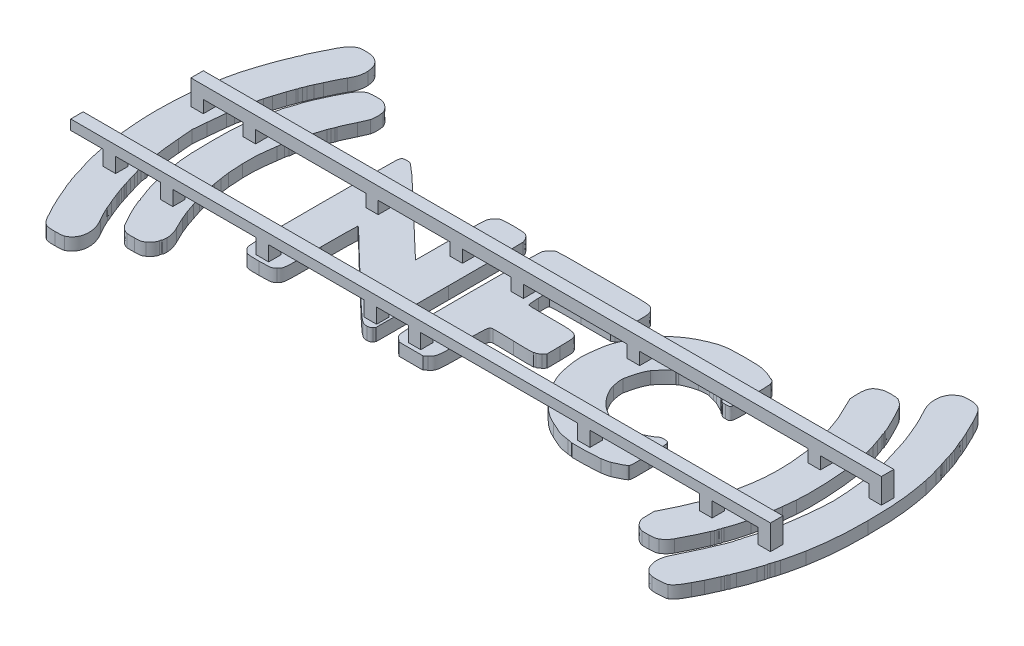
from build123d import *

# Parameters (mm, degrees)
BOSS_EXTRUDE1_DEPTH   = 1
BOSS_EXTRUDE1_2_DEPTH = 1
BOSS_EXTRUDE1_3_DEPTH = 1
BOSS_EXTRUDE1_4_DEPTH = 1
BOSS_EXTRUDE1_5_DEPTH = 1
BOSS_EXTRUDE1_6_DEPTH = 1
BOSS_EXTRUDE1_7_DEPTH = 1
SKETCH2_W             = 59.026199966
SKETCH2_H             = 1
BOSS_EXTRUDE2_DEPTH   = 2
CUT_EXTRUDE1_REACH    = 37.009
SKETCH4_W             = 3.596994585
SKETCH4_H             = 1.2
SKETCH4_W_2           = 2.616413051
SKETCH4_W_3           = 6.71739893
SKETCH4_W_4           = 7.689513477
SKETCH4_W_5           = 2.54659971
SKETCH4_W_6           = 12.619871397
SKETCH4_W_7           = 8.835413359
SKETCH4_W_8           = 3.693279713
SKETCH4_W_9           = 2.710715744
SKETCH4_H_2           = 2
CUT_EXTRUDE2_REACH    = 35.335
SKETCH3_W             = 1.484843139
SKETCH3_H             = 2
SKETCH3_W_2           = 3.913312064
SKETCH3_H_2           = 1
SKETCH3_W_3           = 13.540888697
SKETCH3_W_4           = 8.359758838
SKETCH3_W_5           = 3.900667196
SKETCH3_W_6           = 5.781086419
SKETCH3_W_7           = 8.863527596
SKETCH3_W_8           = 3.209161043
SKETCH3_W_9           = 1.972954974


with BuildPart() as part:
    # Sketch1 → Boss-Extrude1 (new body)
    with BuildSketch(Plane(origin=(0, 0, 0), x_dir=(1, 0, 0), z_dir=(0, 1, 0))):
        with BuildLine():
            Line((-25.79095453, 1.252515317), (-25.89285679, 0.130851317))
            Line((-25.89285679, 0.130851317), (-25.791870454, -1.039580683))
            add(Edge.make_bspline(
                [(-25.791870454, -1.039580683), (-25.697900614, -2.128676803), (-25.65901423, -2.467850623), (-25.548641578, -3.160988683)],
                knots=[0, 0, 0, 0, 1, 1, 1, 1], degree=3))
            add(Edge.make_bspline(
                [(-25.548641578, -3.160988683), (-25.525150642, -3.308511883), (-25.490866738, -3.544884283), (-25.472456818, -3.686261191)],
                knots=[0, 0, 0, 0, 1, 1, 1, 1], degree=3))
            add(Edge.make_bspline(
                [(-25.472456818, -3.686261191), (-25.454045374, -3.827638099), (-25.419872722, -3.955120699), (-25.396517422, -3.969556027)],
                knots=[0, 0, 0, 0, 1, 1, 1, 1], degree=3))
            add(Edge.make_bspline(
                [(-25.396517422, -3.969556027), (-25.373160598, -3.983988307), (-25.354051162, -4.086216703), (-25.354051162, -4.196724991)],
                knots=[0, 0, 0, 0, 1, 1, 1, 1], degree=3))
            add(Edge.make_bspline(
                [(-25.354051162, -4.196724991), (-25.354051162, -4.307231755), (-25.333592986, -4.465043479), (-25.308587194, -4.547414155)],
                knots=[0, 0, 0, 0, 1, 1, 1, 1], degree=3))
            add(Edge.make_bspline(
                [(-25.308587194, -4.547414155), (-25.283582926, -4.629786355), (-25.237146646, -4.795935883), (-25.20539563, -4.916636683)],
                knots=[0, 0, 0, 0, 1, 1, 1, 1], degree=3))
            add(Edge.make_bspline(
                [(-25.20539563, -4.916636683), (-25.173644614, -5.037337483), (-25.129764082, -5.190956683), (-25.107880966, -5.258012683)],
                knots=[0, 0, 0, 0, 1, 1, 1, 1], degree=3))
            add(Edge.make_bspline(
                [(-25.107880966, -5.258012683), (-25.085999374, -5.325068683), (-25.020852946, -5.544524683), (-24.963111634, -5.745692683)],
                knots=[0, 0, 0, 0, 1, 1, 1, 1], degree=3))
            add(Edge.make_bspline(
                [(-24.963111634, -5.745692683), (-24.905371846, -5.946860683), (-24.838036954, -6.149560303), (-24.813482266, -6.196135267)],
                knots=[0, 0, 0, 0, 1, 1, 1, 1], degree=3))
            add(Edge.make_bspline(
                [(-24.813482266, -6.196135267), (-24.788926054, -6.242710231), (-24.768835162, -6.314330611), (-24.768835162, -6.355292683)],
                knots=[0, 0, 0, 0, 1, 1, 1, 1], degree=3))
            add(Edge.make_bspline(
                [(-24.768835162, -6.355292683), (-24.768835162, -6.396254755), (-24.749027734, -6.467875135), (-24.724820518, -6.514450099)],
                knots=[0, 0, 0, 0, 1, 1, 1, 1], degree=3))
            add(Edge.make_bspline(
                [(-24.724820518, -6.514450099), (-24.700611778, -6.561025063), (-24.652767322, -6.697887883), (-24.618500182, -6.818588683)],
                knots=[0, 0, 0, 0, 1, 1, 1, 1], degree=3))
            add(Edge.make_bspline(
                [(-24.618500182, -6.818588683), (-24.584231518, -6.939289483), (-24.542155402, -7.059990283), (-24.524995162, -7.086812683)],
                knots=[0, 0, 0, 0, 1, 1, 1, 1], degree=3))
            add(Edge.make_bspline(
                [(-24.524995162, -7.086812683), (-24.507834922, -7.113635083), (-24.464054974, -7.234335883), (-24.427704526, -7.355036683)],
                knots=[0, 0, 0, 0, 1, 1, 1, 1], degree=3))
            add(Edge.make_bspline(
                [(-24.427704526, -7.355036683), (-24.391354078, -7.475737483), (-24.255727222, -7.809801331), (-24.12631219, -8.097398419)],
                knots=[0, 0, 0, 0, 1, 1, 1, 1], degree=3))
            add(Edge.make_bspline(
                [(-24.12631219, -8.097398419), (-23.996897158, -8.384997031), (-23.891011162, -8.634046063), (-23.891011162, -8.650839019)],
                knots=[0, 0, 0, 0, 1, 1, 1, 1], degree=3))
            add(Edge.make_bspline(
                [(-23.891011162, -8.650839019), (-23.891011162, -8.718018463), (-23.474297746, -9.543287323), (-23.30175199, -9.817820683)],
                knots=[0, 0, 0, 0, 1, 1, 1, 1], degree=3))
            add(Edge.make_bspline(
                [(-23.30175199, -9.817820683), (-22.624497058, -10.895387743), (-22.762953982, -12.052074787), (-23.612890306, -12.417094123)],
                knots=[0, 0, 0, 0, 1, 1, 1, 1], degree=3))
            add(Edge.make_bspline(
                [(-23.612890306, -12.417094123), (-23.694367918, -12.452086687), (-23.979121222, -12.474808003), (-24.320026306, -12.473521747)],
                knots=[0, 0, 0, 0, 1, 1, 1, 1], degree=3))
            add(Edge.make_bspline(
                [(-24.320026306, -12.473521747), (-24.786283438, -12.471753907), (-24.923252938, -12.454195903), (-25.068287446, -12.377564611)],
                knots=[0, 0, 0, 0, 1, 1, 1, 1], degree=3))
            add(Edge.make_bspline(
                [(-25.068287446, -12.377564611), (-25.355238358, -12.225947947), (-25.555365466, -11.929244959), (-26.106012574, -10.839062227)],
                knots=[0, 0, 0, 0, 1, 1, 1, 1], degree=3))
            add(Edge.make_bspline(
                [(-26.106012574, -10.839062227), (-26.242293226, -10.569250219), (-26.395287586, -10.251039019), (-26.446001734, -10.131926227)],
                knots=[0, 0, 0, 0, 1, 1, 1, 1], degree=3))
            add(Edge.make_bspline(
                [(-26.446001734, -10.131926227), (-26.496715882, -10.012813435), (-26.579011882, -9.828938263), (-26.628881734, -9.723315919)],
                knots=[0, 0, 0, 0, 1, 1, 1, 1], degree=3))
            add(Edge.make_bspline(
                [(-26.628881734, -9.723315919), (-26.678751586, -9.617695099), (-26.719555162, -9.513877171), (-26.719555162, -9.492612799)],
                knots=[0, 0, 0, 0, 1, 1, 1, 1], degree=3))
            add(Edge.make_bspline(
                [(-26.719555162, -9.492612799), (-26.719555162, -9.471346903), (-26.807337562, -9.269182207), (-26.914627162, -9.043355887)],
                knots=[0, 0, 0, 0, 1, 1, 1, 1], degree=3))
            add(Edge.make_bspline(
                [(-26.914627162, -9.043355887), (-27.021916762, -8.817531091), (-27.109699162, -8.608325515), (-27.109699162, -8.578455115)],
                knots=[0, 0, 0, 0, 1, 1, 1, 1], degree=3))
            add(Edge.make_bspline(
                [(-27.109699162, -8.578455115), (-27.109699162, -8.548584715), (-27.129084442, -8.486038231), (-27.15277807, -8.439463267)],
                knots=[0, 0, 0, 0, 1, 1, 1, 1], degree=3))
            add(Edge.make_bspline(
                [(-27.15277807, -8.439463267), (-27.257790814, -8.233031371), (-27.425904778, -7.733334631), (-27.501207142, -7.403804683)],
                knots=[0, 0, 0, 0, 1, 1, 1, 1], degree=3))
            add(Edge.make_bspline(
                [(-27.501207142, -7.403804683), (-27.522658966, -7.309926283), (-27.61079341, -7.035606283), (-27.69705943, -6.794204683)],
                knots=[0, 0, 0, 0, 1, 1, 1, 1], degree=3))
            add(Edge.make_bspline(
                [(-27.69705943, -6.794204683), (-27.857196778, -6.346089247), (-27.899685898, -6.199078111), (-27.993056806, -5.770076683)],
                knots=[0, 0, 0, 0, 1, 1, 1, 1], degree=3))
            add(Edge.make_bspline(
                [(-27.993056806, -5.770076683), (-28.022245978, -5.635964683), (-28.065917722, -5.438454283), (-28.090103602, -5.331164683)],
                knots=[0, 0, 0, 0, 1, 1, 1, 1], degree=3))
            add(Edge.make_bspline(
                [(-28.090103602, -5.331164683), (-28.334382514, -4.247562583), (-28.500076366, -3.056824807), (-28.598290546, -1.679128807)],
                knots=[0, 0, 0, 0, 1, 1, 1, 1], degree=3))
            add(Edge.make_bspline(
                [(-28.598290546, -1.679128807), (-28.746171886, 0.395248553), (-28.630299118, 2.645277581), (-28.276534522, 4.568739317)],
                knots=[0, 0, 0, 0, 1, 1, 1, 1], degree=3))
            add(Edge.make_bspline(
                [(-28.276534522, 4.568739317), (-28.246935394, 4.729673717), (-28.204455418, 4.960102517), (-28.18213339, 5.080803317)],
                knots=[0, 0, 0, 0, 1, 1, 1, 1], degree=3))
            add(Edge.make_bspline(
                [(-28.18213339, 5.080803317), (-28.059754666, 5.742545453), (-27.90289087, 6.325289525), (-27.61765141, 7.177827317)],
                knots=[0, 0, 0, 0, 1, 1, 1, 1], degree=3))
            add(Edge.make_bspline(
                [(-27.61765141, 7.177827317), (-27.442656586, 7.700864117), (-27.28093885, 8.172694517), (-27.258278494, 8.226339317)],
                knots=[0, 0, 0, 0, 1, 1, 1, 1], degree=3))
            add(Edge.make_bspline(
                [(-27.258278494, 8.226339317), (-27.235618138, 8.279984117), (-27.19046659, 8.400684917), (-27.157939858, 8.494563317)],
                knots=[0, 0, 0, 0, 1, 1, 1, 1], degree=3))
            add(Edge.make_bspline(
                [(-27.157939858, 8.494563317), (-27.12541465, 8.588441717), (-27.035417878, 8.803397345), (-26.957946862, 8.972241305)],
                knots=[0, 0, 0, 0, 1, 1, 1, 1], degree=3))
            add(Edge.make_bspline(
                [(-26.957946862, 8.972241305), (-26.880475846, 9.141085265), (-26.817091162, 9.299523353), (-26.817091162, 9.324324929)],
                knots=[0, 0, 0, 0, 1, 1, 1, 1], degree=3))
            add(Edge.make_bspline(
                [(-26.817091162, 9.324324929), (-26.817091162, 9.349128029), (-26.773199962, 9.447564713), (-26.719555162, 9.543075317)],
                knots=[0, 0, 0, 0, 1, 1, 1, 1], degree=3))
            add(Edge.make_bspline(
                [(-26.719555162, 9.543075317), (-26.665910362, 9.638585921), (-26.622019162, 9.745898381), (-26.622019162, 9.781547789)],
                knots=[0, 0, 0, 0, 1, 1, 1, 1], degree=3))
            add(Edge.make_bspline(
                [(-26.622019162, 9.781547789), (-26.622019162, 9.817198721), (-26.557627114, 9.975636809), (-26.47892623, 10.133632937)],
                knots=[0, 0, 0, 0, 1, 1, 1, 1], degree=3))
            add(Edge.make_bspline(
                [(-26.47892623, 10.133632937), (-26.400223822, 10.291629065), (-26.24637907, 10.607436917), (-26.137045786, 10.835427317)],
                knots=[0, 0, 0, 0, 1, 1, 1, 1], degree=3))
            add(Edge.make_bspline(
                [(-26.137045786, 10.835427317), (-25.580142658, 11.996736653), (-25.38307117, 12.284326121), (-25.00641457, 12.485373725)],
                knots=[0, 0, 0, 0, 1, 1, 1, 1], degree=3))
            add(Edge.make_bspline(
                [(-25.00641457, 12.485373725), (-24.84374281, 12.572203625), (-24.726739234, 12.591075317), (-24.351088474, 12.591075317)],
                knots=[0, 0, 0, 0, 1, 1, 1, 1], degree=3))
            add(Edge.make_bspline(
                [(-24.351088474, 12.591075317), (-23.802776134, 12.591075317), (-23.473040446, 12.470665601), (-23.214269818, 12.175942289)],
                knots=[0, 0, 0, 0, 1, 1, 1, 1], degree=3))
            add(Edge.make_bspline(
                [(-23.214269818, 12.175942289), (-22.992823474, 11.923729433), (-22.92011191, 11.731975181), (-22.884020542, 11.305017437)],
                knots=[0, 0, 0, 0, 1, 1, 1, 1], degree=3))
            add(Edge.make_bspline(
                [(-22.884020542, 11.305017437), (-22.846976674, 10.866789713), (-22.96369831, 10.428773825), (-23.23657813, 9.981987317)],
                knots=[0, 0, 0, 0, 1, 1, 1, 1], degree=3))
            add(Edge.make_bspline(
                [(-23.23657813, 9.981987317), (-23.392397986, 9.726865145), (-23.615865154, 9.274968665), (-23.875658386, 8.689635317)],
                knots=[0, 0, 0, 0, 1, 1, 1, 1], degree=3))
            add(Edge.make_bspline(
                [(-23.875658386, 8.689635317), (-23.91732607, 8.595756917), (-24.025607794, 8.360466557), (-24.116285794, 8.166766157)],
                knots=[0, 0, 0, 0, 1, 1, 1, 1], degree=3))
            add(Edge.make_bspline(
                [(-24.116285794, 8.166766157), (-24.206963794, 7.973067281), (-24.281155162, 7.796138501), (-24.281155162, 7.773590921)],
                knots=[0, 0, 0, 0, 1, 1, 1, 1], degree=3))
            add(Edge.make_bspline(
                [(-24.281155162, 7.773590921), (-24.281155162, 7.751043341), (-24.325046362, 7.641751205), (-24.378691162, 7.530718661)],
                knots=[0, 0, 0, 0, 1, 1, 1, 1], degree=3))
            add(Edge.make_bspline(
                [(-24.378691162, 7.530718661), (-24.432335962, 7.419687641), (-24.476227162, 7.299253541), (-24.476227162, 7.263089021)],
                knots=[0, 0, 0, 0, 1, 1, 1, 1], degree=3))
            add(Edge.make_bspline(
                [(-24.476227162, 7.263089021), (-24.476227162, 7.226924501), (-24.49420579, 7.176486197), (-24.516180346, 7.151004917)],
                knots=[0, 0, 0, 0, 1, 1, 1, 1], degree=3))
            add(Edge.make_bspline(
                [(-24.516180346, 7.151004917), (-24.538153378, 7.125523637), (-24.629367826, 6.874246517), (-24.718876918, 6.592611317)],
                knots=[0, 0, 0, 0, 1, 1, 1, 1], degree=3))
            add(Edge.make_bspline(
                [(-24.718876918, 6.592611317), (-24.808387534, 6.310976117), (-24.93591433, 5.915955317), (-25.002272338, 5.714787317)],
                knots=[0, 0, 0, 0, 1, 1, 1, 1], degree=3))
            add(Edge.make_bspline(
                [(-25.002272338, 5.714787317), (-25.068630346, 5.513619317), (-25.142007898, 5.266731317), (-25.165334242, 5.166147317)],
                knots=[0, 0, 0, 0, 1, 1, 1, 1], degree=3))
            add(Edge.make_bspline(
                [(-25.165334242, 5.166147317), (-25.18866211, 5.065563317), (-25.23089215, 4.889998517), (-25.259182162, 4.776003317)],
                knots=[0, 0, 0, 0, 1, 1, 1, 1], degree=3))
            add(Edge.make_bspline(
                [(-25.259182162, 4.776003317), (-25.365482686, 4.347646541), (-25.41058699, 4.123396037), (-25.433291542, 3.910371317)],
                knots=[0, 0, 0, 0, 1, 1, 1, 1], degree=3))
            add(Edge.make_bspline(
                [(-25.433291542, 3.910371317), (-25.446154102, 3.789670517), (-25.47595897, 3.647024117), (-25.499521534, 3.593379317)],
                knots=[0, 0, 0, 0, 1, 1, 1, 1], degree=3))
            add(Edge.make_bspline(
                [(-25.499521534, 3.593379317), (-25.523085622, 3.539734517), (-25.556112226, 3.375142517), (-25.57291585, 3.227619317)],
                knots=[0, 0, 0, 0, 1, 1, 1, 1], degree=3))
            add(Edge.make_bspline(
                [(-25.57291585, 3.227619317), (-25.58971795, 3.080096117), (-25.622723218, 2.827721717), (-25.646259874, 2.666787317)],
                knots=[0, 0, 0, 0, 1, 1, 1, 1], degree=3))
            add(Edge.make_bspline(
                [(-25.646259874, 2.666787317), (-25.669795006, 2.505852917), (-25.734907906, 1.869430517), (-25.79095453, 1.252515317)],
                knots=[0, 0, 0, 0, 1, 1, 1, 1], degree=3))
        make_face()
    extrude(amount=BOSS_EXTRUDE1_DEPTH)



with BuildPart() as body_2:
    # Sketch1 → Boss-Extrude1 2 (new body)
    with BuildSketch(Plane(origin=(0, 0, 0), x_dir=(1, 0, 0), z_dir=(0, 1, 0))):
        with BuildLine():
            Line((-20.282183734, -5.965142587), (-20.184647734, -6.208982587))
            add(Edge.make_bspline(
                [(-20.184647734, -6.208982587), (-20.157825334, -6.276038587), (-20.116823638, -6.380280187), (-20.093532346, -6.440630587)],
                knots=[0, 0, 0, 0, 1, 1, 1, 1], degree=3))
            add(Edge.make_bspline(
                [(-20.093532346, -6.440630587), (-20.05080091, -6.551350711), (-19.845432766, -6.970993255), (-19.657968574, -7.330646587)],
                knots=[0, 0, 0, 0, 1, 1, 1, 1], degree=3))
            add(Edge.make_bspline(
                [(-19.657968574, -7.330646587), (-19.473855658, -7.683871687), (-19.355591734, -8.108407795), (-19.355591734, -8.416103395)],
                knots=[0, 0, 0, 0, 1, 1, 1, 1], degree=3))
            add(Edge.make_bspline(
                [(-19.355591734, -8.416103395), (-19.355591734, -8.580373831), (-19.377537334, -8.728342039), (-19.404359734, -8.744918587)],
                knots=[0, 0, 0, 0, 1, 1, 1, 1], degree=3))
            add(Edge.make_bspline(
                [(-19.404359734, -8.744918587), (-19.431182134, -8.761495135), (-19.453127734, -8.829063199), (-19.453127734, -8.895069163)],
                knots=[0, 0, 0, 0, 1, 1, 1, 1], degree=3))
            add(Edge.make_bspline(
                [(-19.453127734, -8.895069163), (-19.453127734, -9.076775683), (-19.66709581, -9.378047623), (-19.919459542, -9.551679991)],
                knots=[0, 0, 0, 0, 1, 1, 1, 1], degree=3))
            add(Edge.make_bspline(
                [(-19.919459542, -9.551679991), (-20.13135955, -9.697470403), (-20.175009958, -9.707763499), (-20.640320686, -9.721650187)],
                knots=[0, 0, 0, 0, 1, 1, 1, 1], degree=3))
            add(Edge.make_bspline(
                [(-20.640320686, -9.721650187), (-20.91273721, -9.729788347), (-21.19910443, -9.725551627), (-21.276689746, -9.712247107)],
                knots=[0, 0, 0, 0, 1, 1, 1, 1], degree=3))
            add(Edge.make_bspline(
                [(-21.276689746, -9.712247107), (-21.491412202, -9.675454699), (-21.784437778, -9.459100039), (-21.955089202, -9.211361647)],
                knots=[0, 0, 0, 0, 1, 1, 1, 1], degree=3))
            add(Edge.make_bspline(
                [(-21.955089202, -9.211361647), (-22.119132562, -8.973216835), (-22.866883162, -7.525977667), (-22.866883162, -7.446624511)],
                knots=[0, 0, 0, 0, 1, 1, 1, 1], degree=3))
            add(Edge.make_bspline(
                [(-22.866883162, -7.446624511), (-22.866883162, -7.420481815), (-22.910774362, -7.308248359), (-22.964419162, -7.197217339)],
                knots=[0, 0, 0, 0, 1, 1, 1, 1], degree=3))
            add(Edge.make_bspline(
                [(-22.964419162, -7.197217339), (-23.018063962, -7.086184795), (-23.061955162, -6.956867299), (-23.061955162, -6.909842755)],
                knots=[0, 0, 0, 0, 1, 1, 1, 1], degree=3))
            add(Edge.make_bspline(
                [(-23.061955162, -6.909842755), (-23.061955162, -6.862819735), (-23.083900762, -6.810781231), (-23.110723162, -6.794204683)],
                knots=[0, 0, 0, 0, 1, 1, 1, 1], degree=3))
            add(Edge.make_bspline(
                [(-23.110723162, -6.794204683), (-23.137545562, -6.777628135), (-23.159491162, -6.732202267), (-23.159491162, -6.693259495)],
                knots=[0, 0, 0, 0, 1, 1, 1, 1], degree=3))
            add(Edge.make_bspline(
                [(-23.159491162, -6.693259495), (-23.159491162, -6.654316723), (-23.200188058, -6.529423399), (-23.24992837, -6.415720807)],
                knots=[0, 0, 0, 0, 1, 1, 1, 1], degree=3))
            add(Edge.make_bspline(
                [(-23.24992837, -6.415720807), (-23.42326051, -6.019494523), (-23.642814046, -5.337993727), (-23.722347034, -4.949317339)],
                knots=[0, 0, 0, 0, 1, 1, 1, 1], degree=3))
            add(Edge.make_bspline(
                [(-23.722347034, -4.949317339), (-23.732390194, -4.900235395), (-23.754675646, -4.815753979), (-23.77186789, -4.761581875)],
                knots=[0, 0, 0, 0, 1, 1, 1, 1], degree=3))
            add(Edge.make_bspline(
                [(-23.77186789, -4.761581875), (-23.789061658, -4.707409771), (-23.809865782, -4.615893571), (-23.81809843, -4.558213219)],
                knots=[0, 0, 0, 0, 1, 1, 1, 1], degree=3))
            add(Edge.make_bspline(
                [(-23.81809843, -4.558213219), (-23.82632803, -4.500532867), (-23.857269802, -4.343612683), (-23.886850642, -4.209500683)],
                knots=[0, 0, 0, 0, 1, 1, 1, 1], degree=3))
            add(Edge.make_bspline(
                [(-23.886850642, -4.209500683), (-23.916431482, -4.075388683), (-23.95334581, -3.899823883), (-23.96888299, -3.819356683)],
                knots=[0, 0, 0, 0, 1, 1, 1, 1], degree=3))
            add(Edge.make_bspline(
                [(-23.96888299, -3.819356683), (-23.984418646, -3.738889483), (-24.02671117, -3.519433483), (-24.062866546, -3.331676683)],
                knots=[0, 0, 0, 0, 1, 1, 1, 1], degree=3))
            add(Edge.make_bspline(
                [(-24.062866546, -3.331676683), (-24.250963198, -2.354858215), (-24.302802058, -1.596703267), (-24.301284154, 0.155235317)],
                knots=[0, 0, 0, 0, 1, 1, 1, 1], degree=3))
            add(Edge.make_bspline(
                [(-24.301284154, 0.155235317), (-24.299714434, 1.970608877), (-24.26266447, 2.447957681), (-24.02898955, 3.663690581)],
                knots=[0, 0, 0, 0, 1, 1, 1, 1], degree=3))
            add(Edge.make_bspline(
                [(-24.02898955, 3.663690581), (-23.974555318, 3.946887881), (-23.911033474, 4.277350517), (-23.887827526, 4.398051317)],
                knots=[0, 0, 0, 0, 1, 1, 1, 1], degree=3))
            add(Edge.make_bspline(
                [(-23.887827526, 4.398051317), (-23.864621578, 4.518752117), (-23.814834022, 4.743694517), (-23.777189698, 4.897923317)],
                knots=[0, 0, 0, 0, 1, 1, 1, 1], degree=3))
            add(Edge.make_bspline(
                [(-23.777189698, 4.897923317), (-23.73954385, 5.052152117), (-23.715002878, 5.178339317), (-23.722654882, 5.178339317)],
                knots=[0, 0, 0, 0, 1, 1, 1, 1], degree=3))
            add(Edge.make_bspline(
                [(-23.722654882, 5.178339317), (-23.730305362, 5.178339317), (-23.659756354, 5.392308917), (-23.565881002, 5.653827317)],
                knots=[0, 0, 0, 0, 1, 1, 1, 1], degree=3))
            add(Edge.make_bspline(
                [(-23.565881002, 5.653827317), (-23.472004126, 5.915345717), (-23.378259838, 6.206124917), (-23.357557822, 6.300003317)],
                knots=[0, 0, 0, 0, 1, 1, 1, 1], degree=3))
            add(Edge.make_bspline(
                [(-23.357557822, 6.300003317), (-23.33685733, 6.393881717), (-23.286342826, 6.547500917), (-23.245304554, 6.641379317)],
                knots=[0, 0, 0, 0, 1, 1, 1, 1], degree=3))
            add(Edge.make_bspline(
                [(-23.245304554, 6.641379317), (-23.204266282, 6.735257717), (-23.100280714, 6.987632117), (-23.014225006, 7.202211317)],
                knots=[0, 0, 0, 0, 1, 1, 1, 1], degree=3))
            add(Edge.make_bspline(
                [(-23.014225006, 7.202211317), (-22.829232742, 7.663483445), (-22.323415618, 8.709842033), (-22.118379706, 9.055395317)],
                knots=[0, 0, 0, 0, 1, 1, 1, 1], degree=3))
            add(Edge.make_bspline(
                [(-22.118379706, 9.055395317), (-21.926392282, 9.378958805), (-21.662443102, 9.654469049), (-21.452611162, 9.750325601)],
                knots=[0, 0, 0, 0, 1, 1, 1, 1], degree=3))
            add(Edge.make_bspline(
                [(-21.452611162, 9.750325601), (-21.221999482, 9.855675149), (-20.37456709, 9.864331469), (-20.135875162, 9.763782521)],
                knots=[0, 0, 0, 0, 1, 1, 1, 1], degree=3))
            add(Edge.make_bspline(
                [(-20.135875162, 9.763782521), (-19.802315758, 9.623263625), (-19.500874654, 9.319912949), (-19.416547162, 9.039902333)],
                knots=[0, 0, 0, 0, 1, 1, 1, 1], degree=3))
            add(Edge.make_bspline(
                [(-19.416547162, 9.039902333), (-19.340621482, 8.787788537), (-19.337506426, 8.241660089), (-19.410679762, 8.010351941)],
                knots=[0, 0, 0, 0, 1, 1, 1, 1], degree=3))
            add(Edge.make_bspline(
                [(-19.410679762, 8.010351941), (-19.440978406, 7.914568541), (-19.581860014, 7.594799813), (-19.723752034, 7.299753413)],
                knots=[0, 0, 0, 0, 1, 1, 1, 1], degree=3))
            add(Edge.make_bspline(
                [(-19.723752034, 7.299753413), (-20.063588794, 6.593100521), (-20.233415734, 6.210520133), (-20.233415734, 6.151597721)],
                knots=[0, 0, 0, 0, 1, 1, 1, 1], degree=3))
            add(Edge.make_bspline(
                [(-20.233415734, 6.151597721), (-20.233415734, 6.125206613), (-20.252801014, 6.065506961), (-20.276494642, 6.018931997)],
                knots=[0, 0, 0, 0, 1, 1, 1, 1], degree=3))
            add(Edge.make_bspline(
                [(-20.276494642, 6.018931997), (-20.300186746, 5.972357033), (-20.341141198, 5.879385413), (-20.367504874, 5.812329413)],
                knots=[0, 0, 0, 0, 1, 1, 1, 1], degree=3))
            add(Edge.make_bspline(
                [(-20.367504874, 5.812329413), (-20.39386855, 5.745273413), (-20.438732062, 5.635545413), (-20.467201906, 5.568489413)],
                knots=[0, 0, 0, 0, 1, 1, 1, 1], degree=3))
            add(Edge.make_bspline(
                [(-20.467201906, 5.568489413), (-20.530379326, 5.419689101), (-20.883770542, 4.311053777), (-20.964653794, 4.007913413)],
                knots=[0, 0, 0, 0, 1, 1, 1, 1], degree=3))
            add(Edge.make_bspline(
                [(-20.964653794, 4.007913413), (-20.996860486, 3.887212613), (-21.04301635, 3.750349793), (-21.06722509, 3.703774829)],
                knots=[0, 0, 0, 0, 1, 1, 1, 1], degree=3))
            add(Edge.make_bspline(
                [(-21.06722509, 3.703774829), (-21.091432306, 3.657199865), (-21.111239734, 3.532308065), (-21.111239734, 3.426237665)],
                knots=[0, 0, 0, 0, 1, 1, 1, 1], degree=3))
            add(Edge.make_bspline(
                [(-21.111239734, 3.426237665), (-21.111239734, 3.320167265), (-21.13034917, 3.221572085), (-21.153705994, 3.207136757)],
                knots=[0, 0, 0, 0, 1, 1, 1, 1], degree=3))
            add(Edge.make_bspline(
                [(-21.153705994, 3.207136757), (-21.177061294, 3.192704477), (-21.211360438, 3.065218829), (-21.22992733, 2.923841921)],
                knots=[0, 0, 0, 0, 1, 1, 1, 1], degree=3))
            add(Edge.make_bspline(
                [(-21.22992733, 2.923841921), (-21.248492698, 2.782465013), (-21.28175857, 2.535119813), (-21.303851998, 2.374185413)],
                knots=[0, 0, 0, 0, 1, 1, 1, 1], degree=3))
            add(Edge.make_bspline(
                [(-21.303851998, 2.374185413), (-21.482906758, 1.069854773), (-21.509438074, 0.689702117), (-21.482533378, -0.186134587)],
                knots=[0, 0, 0, 0, 1, 1, 1, 1], degree=3))
            add(Edge.make_bspline(
                [(-21.482533378, -0.186134587), (-21.46729033, -0.682348987), (-21.433913206, -1.230988987), (-21.408360298, -1.405334587)],
                knots=[0, 0, 0, 0, 1, 1, 1, 1], degree=3))
            add(Edge.make_bspline(
                [(-21.408360298, -1.405334587), (-21.382808914, -1.579680187), (-21.33790273, -1.897891387), (-21.308568778, -2.112470587)],
                knots=[0, 0, 0, 0, 1, 1, 1, 1], degree=3))
            add(Edge.make_bspline(
                [(-21.308568778, -2.112470587), (-21.279234826, -2.327049787), (-21.232644622, -2.612342587), (-21.205034314, -2.746454587)],
                knots=[0, 0, 0, 0, 1, 1, 1, 1], degree=3))
            add(Edge.make_bspline(
                [(-21.205034314, -2.746454587), (-21.177424006, -2.880566587), (-21.136039786, -3.100022587), (-21.11306701, -3.234134587)],
                knots=[0, 0, 0, 0, 1, 1, 1, 1], degree=3))
            add(Edge.make_bspline(
                [(-21.11306701, -3.234134587), (-21.090095758, -3.368246587), (-21.04556143, -3.565756987), (-21.014104546, -3.673046587)],
                knots=[0, 0, 0, 0, 1, 1, 1, 1], degree=3))
            add(Edge.make_bspline(
                [(-21.014104546, -3.673046587), (-20.982646138, -3.780336187), (-20.946245398, -3.933955387), (-20.933215198, -4.014422587)],
                knots=[0, 0, 0, 0, 1, 1, 1, 1], degree=3))
            add(Edge.make_bspline(
                [(-20.933215198, -4.014422587), (-20.920184998, -4.094889787), (-20.891826406, -4.204617787), (-20.870197798, -4.258262587)],
                knots=[0, 0, 0, 0, 1, 1, 1, 1], degree=3))
            add(Edge.make_bspline(
                [(-20.870197798, -4.258262587), (-20.84856919, -4.311907387), (-20.739432502, -4.641091387), (-20.627669962, -4.989782587)],
                knots=[0, 0, 0, 0, 1, 1, 1, 1], degree=3))
            add(Edge.make_bspline(
                [(-20.627669962, -4.989782587), (-20.515907422, -5.338473787), (-20.403425554, -5.673144187), (-20.377709578, -5.733494587)],
                knots=[0, 0, 0, 0, 1, 1, 1, 1], degree=3))
            add(Edge.make_bspline(
                [(-20.377709578, -5.733494587), (-20.351992078, -5.793844987), (-20.309006134, -5.898086587), (-20.282183734, -5.965142587)],
                knots=[0, 0, 0, 0, 1, 1, 1, 1], degree=3))
        make_face()
    extrude(amount=BOSS_EXTRUDE1_2_DEPTH)


with BuildPart() as body_3:
    # Sketch1 → Boss-Extrude1 3 (new body)
    with BuildSketch(Plane(origin=(0, 0, 0), x_dir=(1, 0, 0), z_dir=(0, 1, 0))):
        with BuildLine():
            Line((19.317436838, -8.386586563), (19.317436838, -7.860533767))
            Line((19.317436838, -7.860533767), (19.606205882, -7.278597415))
            add(Edge.make_bspline(
                [(19.606205882, -7.278597415), (19.917223802, -6.651823459), (20.14047761, -6.164320243), (20.241207914, -5.891990587)],
                knots=[0, 0, 0, 0, 1, 1, 1, 1], degree=3))
            add(Edge.make_bspline(
                [(20.241207914, -5.891990587), (20.275932254, -5.798112187), (20.345635442, -5.628273055), (20.39610575, -5.514570463)],
                knots=[0, 0, 0, 0, 1, 1, 1, 1], degree=3))
            add(Edge.make_bspline(
                [(20.39610575, -5.514570463), (20.446576058, -5.400867871), (20.487868838, -5.265001747), (20.487868838, -5.212647775)],
                knots=[0, 0, 0, 0, 1, 1, 1, 1], degree=3))
            add(Edge.make_bspline(
                [(20.487868838, -5.212647775), (20.487868838, -5.160293803), (20.507284598, -5.105458759), (20.531014802, -5.090793307)],
                knots=[0, 0, 0, 0, 1, 1, 1, 1], degree=3))
            add(Edge.make_bspline(
                [(20.531014802, -5.090793307), (20.554743482, -5.076132427), (20.585284442, -5.003509255), (20.598880046, -4.929419995)],
                knots=[0, 0, 0, 0, 1, 1, 1, 1], degree=3))
            add(Edge.make_bspline(
                [(20.598880046, -4.929419995), (20.612474126, -4.855329211), (20.671680002, -4.641091387), (20.730443918, -4.453334587)],
                knots=[0, 0, 0, 0, 1, 1, 1, 1], degree=3))
            add(Edge.make_bspline(
                [(20.730443918, -4.453334587), (20.991649898, -3.618758659), (21.064353842, -3.293828143), (21.270579998, -2.039318587)],
                knots=[0, 0, 0, 0, 1, 1, 1, 1], degree=3))
            add(Edge.make_bspline(
                [(21.270579998, -2.039318587), (21.490857434, -0.699344635), (21.489136838, 0.815686625), (21.265596518, 2.349801413)],
                knots=[0, 0, 0, 0, 1, 1, 1, 1], degree=3))
            add(Edge.make_bspline(
                [(21.265596518, 2.349801413), (21.240191438, 2.524147013), (21.20567741, 2.782413197), (21.188899694, 2.923726097)],
                knots=[0, 0, 0, 0, 1, 1, 1, 1], degree=3))
            add(Edge.make_bspline(
                [(21.188899694, 2.923726097), (21.172120454, 3.065038997), (21.139197482, 3.192520073), (21.115737026, 3.207019409)],
                knots=[0, 0, 0, 0, 1, 1, 1, 1], degree=3))
            add(Edge.make_bspline(
                [(21.115737026, 3.207019409), (21.092278094, 3.221512649), (21.073083314, 3.301851833), (21.073083314, 3.385537721)],
                knots=[0, 0, 0, 0, 1, 1, 1, 1], degree=3))
            add(Edge.make_bspline(
                [(21.073083314, 3.385537721), (21.073083314, 3.469222085), (21.051125522, 3.605088209), (21.024287882, 3.687458885)],
                knots=[0, 0, 0, 0, 1, 1, 1, 1], degree=3))
            add(Edge.make_bspline(
                [(21.024287882, 3.687458885), (20.617602386, 4.935677369), (20.363051714, 5.677453889), (20.287782878, 5.833682177)],
                knots=[0, 0, 0, 0, 1, 1, 1, 1], degree=3))
            add(Edge.make_bspline(
                [(20.287782878, 5.833682177), (20.236894994, 5.939302997), (20.195259314, 6.047127521), (20.195259314, 6.073290029)],
                knots=[0, 0, 0, 0, 1, 1, 1, 1], degree=3))
            add(Edge.make_bspline(
                [(20.195259314, 6.073290029), (20.195259314, 6.111278777), (19.547614178, 7.471671281), (19.362105278, 7.823347997)],
                knots=[0, 0, 0, 0, 1, 1, 1, 1], degree=3))
            add(Edge.make_bspline(
                [(19.362105278, 7.823347997), (19.337536874, 7.869922961), (19.317435314, 8.167552541), (19.317435314, 8.484747233)],
                knots=[0, 0, 0, 0, 1, 1, 1, 1], degree=3))
            add(Edge.make_bspline(
                [(19.317435314, 8.484747233), (19.317435314, 9.295568573), (19.443271994, 9.515864297), (20.048955314, 9.765375101)],
                knots=[0, 0, 0, 0, 1, 1, 1, 1], degree=3))
            add(Edge.make_bspline(
                [(20.048955314, 9.765375101), (20.28004553, 9.860571761), (21.148204322, 9.856392953), (21.316923314, 9.759263861)],
                knots=[0, 0, 0, 0, 1, 1, 1, 1], degree=3))
            add(Edge.make_bspline(
                [(21.316923314, 9.759263861), (21.594128246, 9.599693441), (21.776977766, 9.430893677), (21.94731677, 9.177313793)],
                knots=[0, 0, 0, 0, 1, 1, 1, 1], degree=3))
            add(Edge.make_bspline(
                [(21.94731677, 9.177313793), (22.167261974, 8.849883917), (23.023803314, 7.134242441), (23.023803314, 7.021125065)],
                knots=[0, 0, 0, 0, 1, 1, 1, 1], degree=3))
            add(Edge.make_bspline(
                [(23.023803314, 7.021125065), (23.023803314, 6.976363661), (23.045748914, 6.926178341), (23.072571314, 6.909601793)],
                knots=[0, 0, 0, 0, 1, 1, 1, 1], degree=3))
            add(Edge.make_bspline(
                [(23.072571314, 6.909601793), (23.099393714, 6.893025245), (23.121339314, 6.836567141), (23.121339314, 6.784141541)],
                knots=[0, 0, 0, 0, 1, 1, 1, 1], degree=3))
            add(Edge.make_bspline(
                [(23.121339314, 6.784141541), (23.121339314, 6.731715941), (23.140724594, 6.650715341), (23.164418222, 6.604140377)],
                knots=[0, 0, 0, 0, 1, 1, 1, 1], degree=3))
            add(Edge.make_bspline(
                [(23.164418222, 6.604140377), (23.234927606, 6.465534101), (23.301256658, 6.290292389), (23.38105787, 6.031777793)],
                knots=[0, 0, 0, 0, 1, 1, 1, 1], degree=3))
            add(Edge.make_bspline(
                [(23.38105787, 6.031777793), (23.42245733, 5.897665793), (23.504731994, 5.656264193), (23.563889102, 5.495329793)],
                knots=[0, 0, 0, 0, 1, 1, 1, 1], degree=3))
            add(Edge.make_bspline(
                [(23.563889102, 5.495329793), (23.62304621, 5.334395393), (23.688107294, 5.125912193), (23.708467934, 5.032033793)],
                knots=[0, 0, 0, 0, 1, 1, 1, 1], degree=3))
            add(Edge.make_bspline(
                [(23.708467934, 5.032033793), (23.818878686, 4.522950737), (23.867288546, 4.305797501), (23.909600882, 4.129825793)],
                knots=[0, 0, 0, 0, 1, 1, 1, 1], degree=3))
            add(Edge.make_bspline(
                [(23.909600882, 4.129825793), (24.20947379, 2.882671061), (24.383936738, 0.017392565), (24.24315419, -1.348262311)],
                knots=[0, 0, 0, 0, 1, 1, 1, 1], degree=3))
            add(Edge.make_bspline(
                [(24.24315419, -1.348262311), (24.216414086, -1.607647111), (24.170742854, -2.061271807), (24.141661886, -2.356318207)],
                knots=[0, 0, 0, 0, 1, 1, 1, 1], degree=3))
            add(Edge.make_bspline(
                [(24.141661886, -2.356318207), (24.064684646, -3.137308771), (23.98732793, -3.599632459), (23.77854755, -4.526494207)],
                knots=[0, 0, 0, 0, 1, 1, 1, 1], degree=3))
            add(Edge.make_bspline(
                [(23.77854755, -4.526494207), (23.658773342, -5.058219331), (23.365173218, -6.013026667), (23.265137858, -6.196136791)],
                knots=[0, 0, 0, 0, 1, 1, 1, 1], degree=3))
            add(Edge.make_bspline(
                [(23.265137858, -6.196136791), (23.239693154, -6.242711755), (23.218875314, -6.323712355), (23.218875314, -6.376137955)],
                knots=[0, 0, 0, 0, 1, 1, 1, 1], degree=3))
            add(Edge.make_bspline(
                [(23.218875314, -6.376137955), (23.218875314, -6.428563555), (23.196929714, -6.485021659), (23.170107314, -6.501598207)],
                knots=[0, 0, 0, 0, 1, 1, 1, 1], degree=3))
            add(Edge.make_bspline(
                [(23.170107314, -6.501598207), (23.143284914, -6.518174755), (23.121339314, -6.580917835), (23.121339314, -6.641027443)],
                knots=[0, 0, 0, 0, 1, 1, 1, 1], degree=3))
            add(Edge.make_bspline(
                [(23.121339314, -6.641027443), (23.121339314, -6.701135527), (23.102911106, -6.771163327), (23.08038791, -6.796644607)],
                knots=[0, 0, 0, 0, 1, 1, 1, 1], degree=3))
            add(Edge.make_bspline(
                [(23.08038791, -6.796644607), (23.057864714, -6.822125887), (23.011618934, -6.919783807), (22.977620018, -7.013662207)],
                knots=[0, 0, 0, 0, 1, 1, 1, 1], degree=3))
            add(Edge.make_bspline(
                [(22.977620018, -7.013662207), (22.875789386, -7.294838683), (22.399210202, -8.283934495), (22.040315822, -8.958949147)],
                knots=[0, 0, 0, 0, 1, 1, 1, 1], degree=3))
            add(Edge.make_bspline(
                [(22.040315822, -8.958949147), (21.895159394, -9.231961555), (21.686188514, -9.453025375), (21.438843314, -9.595226767)],
                knots=[0, 0, 0, 0, 1, 1, 1, 1], degree=3))
            add(Edge.make_bspline(
                [(21.438843314, -9.595226767), (21.278584046, -9.687360187), (21.156737198, -9.710270479), (20.756091314, -9.723602431)],
                knots=[0, 0, 0, 0, 1, 1, 1, 1], degree=3))
            add(Edge.make_bspline(
                [(20.756091314, -9.723602431), (20.487867314, -9.732533071), (20.224520114, -9.728448751), (20.170875314, -9.714549871)],
                knots=[0, 0, 0, 0, 1, 1, 1, 1], degree=3))
            add(Edge.make_bspline(
                [(20.170875314, -9.714549871), (19.845679622, -9.630268099), (19.605776114, -9.433076215), (19.41957989, -9.097003735)],
                knots=[0, 0, 0, 0, 1, 1, 1, 1], degree=3))
            add(Edge.make_bspline(
                [(19.41957989, -9.097003735), (19.333608002, -8.941828531), (19.317436838, -8.829355807), (19.317436838, -8.386586563)],
                knots=[0, 0, 0, 0, 1, 1, 1, 1], degree=3))
        make_face()
    extrude(amount=BOSS_EXTRUDE1_3_DEPTH)


with BuildPart() as body_4:
    # Sketch1 → Boss-Extrude1 4 (new body)
    with BuildSketch(Plane(origin=(0, 0, 0), x_dir=(1, 0, 0), z_dir=(0, 1, 0))):
        with BuildLine():
            Line((-4.687861354, -0.438591283), (-4.700815354, -6.226223599))
            Line((-4.700815354, -6.226223599), (-4.803289114, -6.363903283))
            add(Edge.make_bspline(
                [(-4.803289114, -6.363903283), (-4.887665374, -6.477266023), (-4.947954814, -6.504077755), (-5.144665114, -6.515711971)],
                knots=[0, 0, 0, 0, 1, 1, 1, 1], degree=3))
            add(Edge.make_bspline(
                [(-5.144665114, -6.515711971), (-5.341532386, -6.527355331), (-5.422180942, -6.504464851), (-5.603023354, -6.385565419)],
                knots=[0, 0, 0, 0, 1, 1, 1, 1], degree=3))
            add(Edge.make_bspline(
                [(-5.603023354, -6.385565419), (-5.723711962, -6.306227503), (-5.940002614, -6.129789451), (-6.083657902, -5.993496607)],
                knots=[0, 0, 0, 0, 1, 1, 1, 1], degree=3))
            add(Edge.make_bspline(
                [(-6.083657902, -5.993496607), (-6.22731319, -5.857205287), (-6.35173255, -5.745692683), (-6.36014503, -5.745692683)],
                knots=[0, 0, 0, 0, 1, 1, 1, 1], degree=3))
            add(Edge.make_bspline(
                [(-6.36014503, -5.745692683), (-6.36855751, -5.745692683), (-6.700906858, -5.431343299), (-7.09869829, -5.047139851)],
                knots=[0, 0, 0, 0, 1, 1, 1, 1], degree=3))
            add(Edge.make_bspline(
                [(-7.09869829, -5.047139851), (-8.049098218, -4.129202647), (-9.049880062, -3.172278475), (-9.50413417, -2.747120575)],
                knots=[0, 0, 0, 0, 1, 1, 1, 1], degree=3))
            add(Edge.make_bspline(
                [(-9.50413417, -2.747120575), (-9.70512691, -2.559001063), (-10.230379606, -2.053955083), (-10.671362722, -1.624796683)],
                knots=[0, 0, 0, 0, 1, 1, 1, 1], degree=3))
            add(Edge.make_bspline(
                [(-10.671362722, -1.624796683), (-12.299095306, -0.040709935), (-12.44975947, 0.100339313), (-12.488513266, 0.076389653)],
                knots=[0, 0, 0, 0, 1, 1, 1, 1], degree=3))
            add(Edge.make_bspline(
                [(-12.488513266, 0.076389653), (-12.510268366, 0.062947973), (-12.528067162, -1.227899839), (-12.528067162, -2.792151727)],
                knots=[0, 0, 0, 0, 1, 1, 1, 1], degree=3))
            add(Edge.make_bspline(
                [(-12.528067162, -2.792151727), (-12.528067162, -5.887090927), (-12.523495162, -5.832565255), (-12.804488758, -6.093301843)],
                knots=[0, 0, 0, 0, 1, 1, 1, 1], degree=3))
            add(Edge.make_bspline(
                [(-12.804488758, -6.093301843), (-13.04729701, -6.318611527), (-13.110866098, -6.330908683), (-14.032716934, -6.330908683)],
                knots=[0, 0, 0, 0, 1, 1, 1, 1], degree=3))
            add(Edge.make_bspline(
                [(-14.032716934, -6.330908683), (-14.99099899, -6.330908683), (-15.070112878, -6.312128431), (-15.300247546, -6.030005551)],
                knots=[0, 0, 0, 0, 1, 1, 1, 1], degree=3))
            add(Edge.make_bspline(
                [(-15.300247546, -6.030005551), (-15.590849962, -5.673753787), (-15.57843241, -5.962649323), (-15.569203066, 0.226820645)],
                knots=[0, 0, 0, 0, 1, 1, 1, 1], degree=3))
            add(Edge.make_bspline(
                [(-15.569203066, 0.226820645), (-15.564570106, 3.337356461), (-15.545501818, 6.024919793), (-15.526838914, 6.199183097)],
                knots=[0, 0, 0, 0, 1, 1, 1, 1], degree=3))
            add(Edge.make_bspline(
                [(-15.526838914, 6.199183097), (-15.50482321, 6.404769173), (-15.464697814, 6.537488237), (-15.41256787, 6.577150337)],
                knots=[0, 0, 0, 0, 1, 1, 1, 1], degree=3))
            add(Edge.make_bspline(
                [(-15.41256787, 6.577150337), (-15.308397898, 6.656407481), (-14.968602286, 6.658176845), (-14.78480179, 6.580426937)],
                knots=[0, 0, 0, 0, 1, 1, 1, 1], degree=3))
            add(Edge.make_bspline(
                [(-14.78480179, 6.580426937), (-14.609093734, 6.506092313), (-13.579041946, 5.573216861), (-12.482796742, 4.495594937)],
                knots=[0, 0, 0, 0, 1, 1, 1, 1], degree=3))
            add(Edge.make_bspline(
                [(-12.482796742, 4.495594937), (-12.250866802, 4.267604537), (-11.788972882, 3.828692537), (-11.456364454, 3.520234937)],
                knots=[0, 0, 0, 0, 1, 1, 1, 1], degree=3))
            add(Edge.make_bspline(
                [(-11.456364454, 3.520234937), (-11.12375755, 3.211777337), (-10.71851071, 2.827729337), (-10.555814566, 2.666794937)],
                knots=[0, 0, 0, 0, 1, 1, 1, 1], degree=3))
            add(Edge.make_bspline(
                [(-10.555814566, 2.666794937), (-10.393119946, 2.505860537), (-9.876037414, 2.009923505), (-9.406741426, 1.564712813)],
                knots=[0, 0, 0, 0, 1, 1, 1, 1], degree=3))
            add(Edge.make_bspline(
                [(-9.406741426, 1.564712813), (-8.937443914, 1.119502121), (-8.389558294, 0.598294121), (-8.189214778, 0.406472813)],
                knots=[0, 0, 0, 0, 1, 1, 1, 1], degree=3))
            add(Edge.make_bspline(
                [(-8.189214778, 0.406472813), (-7.988871262, 0.214651505), (-7.818792862, 0.057706937), (-7.811262778, 0.057706937)],
                knots=[0, 0, 0, 0, 1, 1, 1, 1], degree=3))
            add(Edge.make_bspline(
                [(-7.811262778, 0.057706937), (-7.803734218, 0.057706937), (-7.797577258, 1.278627533), (-7.797577258, 2.770864325)],
                knots=[0, 0, 0, 0, 1, 1, 1, 1], degree=3))
            add(Edge.make_bspline(
                [(-7.797577258, 2.770864325), (-7.797577258, 4.689720533), (-7.78093213, 5.542788677), (-7.740718342, 5.684752325)],
                knots=[0, 0, 0, 0, 1, 1, 1, 1], degree=3))
            add(Edge.make_bspline(
                [(-7.740718342, 5.684752325), (-7.678680874, 5.903766365), (-7.45882711, 6.171097301), (-7.251358894, 6.279787457)],
                knots=[0, 0, 0, 0, 1, 1, 1, 1], degree=3))
            add(Edge.make_bspline(
                [(-7.251358894, 6.279787457), (-7.060299586, 6.379882253), (-5.411863462, 6.378528941), (-5.217690622, 6.278126297)],
                knots=[0, 0, 0, 0, 1, 1, 1, 1], degree=3))
            add(Edge.make_bspline(
                [(-5.217690622, 6.278126297), (-4.982298154, 6.156399845), (-4.78647787, 5.888152985), (-4.728503386, 5.608009781)],
                knots=[0, 0, 0, 0, 1, 1, 1, 1], degree=3))
            add(Edge.make_bspline(
                [(-4.728503386, 5.608009781), (-4.69087735, 5.426192009), (-4.67876917, 3.624831629), (-4.687861354, -0.438591283)],
                knots=[0, 0, 0, 0, 1, 1, 1, 1], degree=3))
        make_face()
    extrude(amount=BOSS_EXTRUDE1_4_DEPTH)


with BuildPart() as body_5:
    # Sketch1 → Boss-Extrude1 5 (new body)
    with BuildSketch(Plane(origin=(0, 0, 0), x_dir=(1, 0, 0), z_dir=(0, 1, 0))):
        with BuildLine():
            Line((4.937035322, 3.367345733), (4.716709118, 3.227619317))
            Line((4.716709118, 3.227619317), (2.328273458, 3.227619317))
            add(Edge.make_bspline(
                [(2.328273458, 3.227619317), (0.21743135, 3.227619317), (-0.070083442, 3.218642957), (-0.145515346, 3.150375377)],
                knots=[0, 0, 0, 0, 1, 1, 1, 1], degree=3))
            add(Edge.make_bspline(
                [(-0.145515346, 3.150375377), (-0.222084154, 3.081082145), (-0.228081094, 2.997016781), (-0.203783962, 2.333511377)],
                knots=[0, 0, 0, 0, 1, 1, 1, 1], degree=3))
            add(Edge.make_bspline(
                [(-0.203783962, 2.333511377), (-0.188894482, 1.926720725), (-0.156920962, 1.555486517), (-0.132747274, 1.508547317)],
                knots=[0, 0, 0, 0, 1, 1, 1, 1], degree=3))
            add(Edge.make_bspline(
                [(-0.132747274, 1.508547317), (-0.092160106, 1.429736705), (0.04267427, 1.423146929), (1.628560862, 1.422468749)],
                knots=[0, 0, 0, 0, 1, 1, 1, 1], degree=3))
            add(Edge.make_bspline(
                [(1.628560862, 1.422468749), (4.114402982, 1.421401949), (4.002451466, 1.495570457), (4.018529666, -0.160820947)],
                knots=[0, 0, 0, 0, 1, 1, 1, 1], degree=3))
            Line((4.018529666, -0.160820947), (4.028664266, -1.205298919))
            Line((4.028664266, -1.205298919), (3.83588741, -1.402856563))
            add(Edge.make_bspline(
                [(3.83588741, -1.402856563), (3.729859682, -1.511511667), (3.597088802, -1.600412683), (3.54084101, -1.600412683)],
                knots=[0, 0, 0, 0, 1, 1, 1, 1], degree=3))
            add(Edge.make_bspline(
                [(3.54084101, -1.600412683), (3.484593218, -1.600412683), (3.415562114, -1.623422035), (3.387438218, -1.651545931)],
                knots=[0, 0, 0, 0, 1, 1, 1, 1], degree=3))
            add(Edge.make_bspline(
                [(3.387438218, -1.651545931), (3.351997598, -1.686986551), (2.857107554, -1.688684287), (1.774785614, -1.657078051)],
                knots=[0, 0, 0, 0, 1, 1, 1, 1], degree=3))
            add(Edge.make_bspline(
                [(1.774785614, -1.657078051), (0.915950654, -1.631996059), (0.15681425, -1.622266843), (0.087819722, -1.635457063)],
                knots=[0, 0, 0, 0, 1, 1, 1, 1], degree=3))
            add(Edge.make_bspline(
                [(0.087819722, -1.635457063), (-0.183429418, -1.687308115), (-0.180099478, -1.664365819), (-0.214936594, -3.721822207)],
                knots=[0, 0, 0, 0, 1, 1, 1, 1], degree=3))
            add(Edge.make_bspline(
                [(-0.214936594, -3.721822207), (-0.251059966, -5.855278951), (-0.243252514, -5.807845975), (-0.611713042, -6.132179083)],
                knots=[0, 0, 0, 0, 1, 1, 1, 1], degree=3))
            Line((-0.611713042, -6.132179083), (-0.837479926, -6.330908683))
            Line((-0.837479926, -6.330908683), (-1.799107162, -6.330908683))
            Line((-1.799107162, -6.330908683), (-2.760734398, -6.330908683))
            Line((-2.760734398, -6.330908683), (-2.984026306, -6.134359927))
            add(Edge.make_bspline(
                [(-2.984026306, -6.134359927), (-3.381962518, -5.784082243), (-3.359683162, -6.150616435), (-3.359683162, 0.045735917)],
                knots=[0, 0, 0, 0, 1, 1, 1, 1], degree=3))
            add(Edge.make_bspline(
                [(-3.359683162, 0.045735917), (-3.359683162, 3.997384097), (-3.34435477, 5.550943601), (-3.304180606, 5.670934217)],
                knots=[0, 0, 0, 0, 1, 1, 1, 1], degree=3))
            add(Edge.make_bspline(
                [(-3.304180606, 5.670934217), (-3.22883557, 5.895969581), (-3.038916214, 6.142548209), (-2.854161694, 6.255205337)],
                knots=[0, 0, 0, 0, 1, 1, 1, 1], degree=3))
            add(Edge.make_bspline(
                [(-2.854161694, 6.255205337), (-2.707272478, 6.344773865), (-2.558514838, 6.348413177), (0.962521046, 6.348588437)],
                knots=[0, 0, 0, 0, 1, 1, 1, 1], degree=3))
            add(Edge.make_bspline(
                [(0.962521046, 6.348588437), (4.989191174, 6.348740837), (4.811332754, 6.361694837), (5.109355526, 6.047782841)],
                knots=[0, 0, 0, 0, 1, 1, 1, 1], degree=3))
            add(Edge.make_bspline(
                [(5.109355526, 6.047782841), (5.341840202, 5.802906521), (5.379358034, 5.600840885), (5.361336734, 4.690659317)],
                knots=[0, 0, 0, 0, 1, 1, 1, 1], degree=3))
            add(Edge.make_bspline(
                [(5.361336734, 4.690659317), (5.342617442, 3.745241345), (5.294046038, 3.593755745), (4.937035322, 3.367345733)],
                knots=[0, 0, 0, 0, 1, 1, 1, 1], degree=3))
        make_face()
    extrude(amount=BOSS_EXTRUDE1_5_DEPTH)


with BuildPart() as body_6:
    # Sketch1 → Boss-Extrude1 6 (new body)
    with BuildSketch(Plane(origin=(0, 0, 0), x_dir=(1, 0, 0), z_dir=(0, 1, 0))):
        with BuildLine():
            add(Edge.make_bspline(
                [(23.730940838, -12.482379235), (23.488879346, -12.437174347), (23.37686687, -12.376218919), (23.211054146, -12.199457779)],
                knots=[0, 0, 0, 0, 1, 1, 1, 1], degree=3))
            add(Edge.make_bspline(
                [(23.211054146, -12.199457779), (22.880326334, -11.846892571), (22.760300666, -11.321447851), (22.881969206, -10.758800767)],
                knots=[0, 0, 0, 0, 1, 1, 1, 1], degree=3))
            add(Edge.make_bspline(
                [(22.881969206, -10.758800767), (22.92223481, -10.572598447), (23.103494798, -10.144784215), (23.342642402, -9.671516683)],
                knots=[0, 0, 0, 0, 1, 1, 1, 1], degree=3))
            add(Edge.make_bspline(
                [(23.342642402, -9.671516683), (23.559499982, -9.242358283), (23.793778406, -8.748242431), (23.863262138, -8.573480779)],
                knots=[0, 0, 0, 0, 1, 1, 1, 1], degree=3))
            add(Edge.make_bspline(
                [(23.863262138, -8.573480779), (23.932747394, -8.398720651), (24.045281078, -8.135373451), (24.113338346, -7.988264779)],
                knots=[0, 0, 0, 0, 1, 1, 1, 1], degree=3))
            add(Edge.make_bspline(
                [(24.113338346, -7.988264779), (24.412702238, -7.341188095), (24.631361186, -6.752123995), (24.632438654, -6.589819519)],
                knots=[0, 0, 0, 0, 1, 1, 1, 1], degree=3))
            add(Edge.make_bspline(
                [(24.632438654, -6.589819519), (24.632895854, -6.531051031), (24.655094438, -6.469405231), (24.681916838, -6.452828683)],
                knots=[0, 0, 0, 0, 1, 1, 1, 1], degree=3))
            add(Edge.make_bspline(
                [(24.681916838, -6.452828683), (24.708739238, -6.436252135), (24.730684838, -6.370151683), (24.730684838, -6.305940991)],
                knots=[0, 0, 0, 0, 1, 1, 1, 1], degree=3))
            add(Edge.make_bspline(
                [(24.730684838, -6.305940991), (24.730684838, -6.241730299), (24.750344438, -6.138784099), (24.77437487, -6.077171827)],
                knots=[0, 0, 0, 0, 1, 1, 1, 1], degree=3))
            add(Edge.make_bspline(
                [(24.77437487, -6.077171827), (24.798403778, -6.015559555), (24.845458802, -5.866393483), (24.878942606, -5.745692683)],
                knots=[0, 0, 0, 0, 1, 1, 1, 1], degree=3))
            add(Edge.make_bspline(
                [(24.878942606, -5.745692683), (24.91242641, -5.624991883), (24.979148654, -5.394563083), (25.02721409, -5.233628683)],
                knots=[0, 0, 0, 0, 1, 1, 1, 1], degree=3))
            add(Edge.make_bspline(
                [(25.02721409, -5.233628683), (25.21771409, -4.595792011), (25.315900838, -4.185874111), (25.315900838, -4.028391571)],
                knots=[0, 0, 0, 0, 1, 1, 1, 1], degree=3))
            add(Edge.make_bspline(
                [(25.315900838, -4.028391571), (25.315900838, -3.937562695), (25.335718934, -3.842399563), (25.35994139, -3.816918283)],
                knots=[0, 0, 0, 0, 1, 1, 1, 1], degree=3))
            add(Edge.make_bspline(
                [(25.35994139, -3.816918283), (25.384162322, -3.791437003), (25.41587219, -3.671833483), (25.430406578, -3.551132683)],
                knots=[0, 0, 0, 0, 1, 1, 1, 1], degree=3))
            add(Edge.make_bspline(
                [(25.430406578, -3.551132683), (25.444945538, -3.430431883), (25.480137746, -3.189030283), (25.50862283, -3.014684683)],
                knots=[0, 0, 0, 0, 1, 1, 1, 1], degree=3))
            add(Edge.make_bspline(
                [(25.50862283, -3.014684683), (25.666277582, -2.049736651), (25.798272746, -0.649543363), (25.80055265, 0.082083317)],
                knots=[0, 0, 0, 0, 1, 1, 1, 1], degree=3))
            add(Edge.make_bspline(
                [(25.80055265, 0.082083317), (25.80219857, 0.610286477), (25.716581774, 1.710551993), (25.60321751, 2.618019317)],
                knots=[0, 0, 0, 0, 1, 1, 1, 1], degree=3))
            add(Edge.make_bspline(
                [(25.60321751, 2.618019317), (25.57976315, 2.805776117), (25.547026106, 3.091068917), (25.53046937, 3.252003317)],
                knots=[0, 0, 0, 0, 1, 1, 1, 1], degree=3))
            add(Edge.make_bspline(
                [(25.53046937, 3.252003317), (25.513912634, 3.412937717), (25.480806782, 3.565459637), (25.456901318, 3.590940917)],
                knots=[0, 0, 0, 0, 1, 1, 1, 1], degree=3))
            add(Edge.make_bspline(
                [(25.456901318, 3.590940917), (25.432995854, 3.616422197), (25.413436838, 3.713619869), (25.413436838, 3.806934389)],
                knots=[0, 0, 0, 0, 1, 1, 1, 1], degree=3))
            add(Edge.make_bspline(
                [(25.413436838, 3.806934389), (25.413436838, 3.900250433), (25.392978662, 4.043994113), (25.36797287, 4.126364789)],
                knots=[0, 0, 0, 0, 1, 1, 1, 1], degree=3))
            add(Edge.make_bspline(
                [(25.36797287, 4.126364789), (25.342968602, 4.208736989), (25.299077402, 4.369400117), (25.27043687, 4.483395317)],
                knots=[0, 0, 0, 0, 1, 1, 1, 1], degree=3))
            add(Edge.make_bspline(
                [(25.27043687, 4.483395317), (25.241797862, 4.597390517), (25.19470169, 4.783928117), (25.165780742, 4.897923317)],
                knots=[0, 0, 0, 0, 1, 1, 1, 1], degree=3))
            add(Edge.make_bspline(
                [(25.165780742, 4.897923317), (25.08192569, 5.228440817), (24.765790178, 6.257902817), (24.682802282, 6.470691317)],
                knots=[0, 0, 0, 0, 1, 1, 1, 1], degree=3))
            add(Edge.make_bspline(
                [(24.682802282, 6.470691317), (24.66188081, 6.524336117), (24.594178634, 6.732819317), (24.532351478, 6.933987317)],
                knots=[0, 0, 0, 0, 1, 1, 1, 1], degree=3))
            add(Edge.make_bspline(
                [(24.532351478, 6.933987317), (24.470525846, 7.135155317), (24.404935934, 7.321692917), (24.386596118, 7.348515317)],
                knots=[0, 0, 0, 0, 1, 1, 1, 1], degree=3))
            add(Edge.make_bspline(
                [(24.386596118, 7.348515317), (24.368256302, 7.375337717), (24.32494727, 7.485065717), (24.290350946, 7.592355317)],
                knots=[0, 0, 0, 0, 1, 1, 1, 1], degree=3))
            add(Edge.make_bspline(
                [(24.290350946, 7.592355317), (24.255756146, 7.699644917), (24.154140398, 7.944001553), (24.064539866, 8.135370233)],
                knots=[0, 0, 0, 0, 1, 1, 1, 1], degree=3))
            add(Edge.make_bspline(
                [(24.064539866, 8.135370233), (23.974939334, 8.326738913), (23.901628838, 8.495214065), (23.901628838, 8.509760645)],
                knots=[0, 0, 0, 0, 1, 1, 1, 1], degree=3))
            add(Edge.make_bspline(
                [(23.901628838, 8.509760645), (23.901628838, 8.573268773), (23.528494202, 9.338510321), (23.290771538, 9.762531317)],
                knots=[0, 0, 0, 0, 1, 1, 1, 1], degree=3))
            add(Edge.make_bspline(
                [(23.290771538, 9.762531317), (22.96185881, 10.349208833), (22.828732838, 10.756468877), (22.828732838, 11.176006265)],
                knots=[0, 0, 0, 0, 1, 1, 1, 1], degree=3))
            add(Edge.make_bspline(
                [(22.828732838, 11.176006265), (22.828732838, 11.811555413), (23.056220318, 12.220546721), (23.554780154, 12.481347317)],
                knots=[0, 0, 0, 0, 1, 1, 1, 1], degree=3))
            add(Edge.make_bspline(
                [(23.554780154, 12.481347317), (23.72907089, 12.572520617), (23.84219741, 12.591075317), (24.22376129, 12.591075317)],
                knots=[0, 0, 0, 0, 1, 1, 1, 1], degree=3))
            add(Edge.make_bspline(
                [(24.22376129, 12.591075317), (25.064157374, 12.591075317), (25.301636198, 12.394080029), (25.902197354, 11.198762633)],
                knots=[0, 0, 0, 0, 1, 1, 1, 1], degree=3))
            add(Edge.make_bspline(
                [(25.902197354, 11.198762633), (26.130625142, 10.744115333), (26.358272642, 10.273376117), (26.408081534, 10.152675317)],
                knots=[0, 0, 0, 0, 1, 1, 1, 1], degree=3))
            add(Edge.make_bspline(
                [(26.408081534, 10.152675317), (26.457890426, 10.031974517), (26.561711402, 9.798407801), (26.638792274, 9.633639017)],
                knots=[0, 0, 0, 0, 1, 1, 1, 1], degree=3))
            add(Edge.make_bspline(
                [(26.638792274, 9.633639017), (26.71587467, 9.468870233), (26.778940838, 9.311838797), (26.778940838, 9.284679593)],
                knots=[0, 0, 0, 0, 1, 1, 1, 1], degree=3))
            add(Edge.make_bspline(
                [(26.778940838, 9.284679593), (26.778940838, 9.257521913), (26.825948618, 9.139957505), (26.883401894, 9.023427893)],
                knots=[0, 0, 0, 0, 1, 1, 1, 1], degree=3))
            add(Edge.make_bspline(
                [(26.883401894, 9.023427893), (26.94085517, 8.906898281), (27.00669197, 8.762177717), (27.029705894, 8.701827317)],
                knots=[0, 0, 0, 0, 1, 1, 1, 1], degree=3))
            add(Edge.make_bspline(
                [(27.029705894, 8.701827317), (27.052719818, 8.641476917), (27.09204359, 8.542721717), (27.117093578, 8.482371317)],
                knots=[0, 0, 0, 0, 1, 1, 1, 1], degree=3))
            add(Edge.make_bspline(
                [(27.117093578, 8.482371317), (27.142142042, 8.422020917), (27.189075146, 8.284860917), (27.221386994, 8.177571317)],
                knots=[0, 0, 0, 0, 1, 1, 1, 1], degree=3))
            add(Edge.make_bspline(
                [(27.221386994, 8.177571317), (27.253698842, 8.070281717), (27.296538482, 7.938608117), (27.316588226, 7.884963317)],
                knots=[0, 0, 0, 0, 1, 1, 1, 1], degree=3))
            add(Edge.make_bspline(
                [(27.316588226, 7.884963317), (27.336636446, 7.831318517), (27.379625438, 7.688672117), (27.412118642, 7.567971317)],
                knots=[0, 0, 0, 0, 1, 1, 1, 1], degree=3))
            add(Edge.make_bspline(
                [(27.412118642, 7.567971317), (27.44461337, 7.447270517), (27.491005454, 7.310407697), (27.515214194, 7.263832733)],
                knots=[0, 0, 0, 0, 1, 1, 1, 1], degree=3))
            add(Edge.make_bspline(
                [(27.515214194, 7.263832733), (27.53942141, 7.217257769), (27.559228838, 7.136257169), (27.559228838, 7.083831569)],
                knots=[0, 0, 0, 0, 1, 1, 1, 1], degree=3))
            add(Edge.make_bspline(
                [(27.559228838, 7.083831569), (27.559228838, 7.031405969), (27.578644598, 6.976511489), (27.602374802, 6.961846037)],
                knots=[0, 0, 0, 0, 1, 1, 1, 1], degree=3))
            add(Edge.make_bspline(
                [(27.602374802, 6.961846037), (27.626103482, 6.947185157), (27.656644442, 6.874561985), (27.670240046, 6.800472725)],
                knots=[0, 0, 0, 0, 1, 1, 1, 1], degree=3))
            add(Edge.make_bspline(
                [(27.670240046, 6.800472725), (27.683834126, 6.726381941), (27.742564514, 6.512144117), (27.800746262, 6.324387317)],
                knots=[0, 0, 0, 0, 1, 1, 1, 1], degree=3))
            add(Edge.make_bspline(
                [(27.800746262, 6.324387317), (27.93240005, 5.899531169), (28.016114894, 5.576651957), (28.088405834, 5.214915317)],
                knots=[0, 0, 0, 0, 1, 1, 1, 1], degree=3))
            add(Edge.make_bspline(
                [(28.088405834, 5.214915317), (28.444736846, 3.431861225), (28.559155718, 2.182403729), (28.558442486, 0.082083317)],
                knots=[0, 0, 0, 0, 1, 1, 1, 1], degree=3))
            add(Edge.make_bspline(
                [(28.558442486, 0.082083317), (28.557832886, -1.767921619), (28.451280902, -3.085913395), (28.185928118, -4.526492683)],
                knots=[0, 0, 0, 0, 1, 1, 1, 1], degree=3))
            add(Edge.make_bspline(
                [(28.185928118, -4.526492683), (28.10018483, -4.991990863), (27.869810894, -6.000333271), (27.807102866, -6.184604683)],
                knots=[0, 0, 0, 0, 1, 1, 1, 1], degree=3))
            add(Edge.make_bspline(
                [(27.807102866, -6.184604683), (27.78428249, -6.251660683), (27.738983114, -6.405279883), (27.706435046, -6.525980683)],
                knots=[0, 0, 0, 0, 1, 1, 1, 1], degree=3))
            add(Edge.make_bspline(
                [(27.706435046, -6.525980683), (27.673888502, -6.646681483), (27.627452222, -6.783544303), (27.603243482, -6.830119267)],
                knots=[0, 0, 0, 0, 1, 1, 1, 1], degree=3))
            add(Edge.make_bspline(
                [(27.603243482, -6.830119267), (27.579036266, -6.876694231), (27.559228838, -6.959287411), (27.559228838, -7.013660683)],
                knots=[0, 0, 0, 0, 1, 1, 1, 1], degree=3))
            add(Edge.make_bspline(
                [(27.559228838, -7.013660683), (27.559228838, -7.068033955), (27.539537234, -7.150627135), (27.515470226, -7.197202099)],
                knots=[0, 0, 0, 0, 1, 1, 1, 1], degree=3))
            add(Edge.make_bspline(
                [(27.515470226, -7.197202099), (27.491403218, -7.243777063), (27.422890274, -7.446476683), (27.363218054, -7.647644683)],
                knots=[0, 0, 0, 0, 1, 1, 1, 1], degree=3))
            add(Edge.make_bspline(
                [(27.363218054, -7.647644683), (27.230372498, -8.095502563), (27.098037482, -8.453685235), (26.916824738, -8.855873407)],
                knots=[0, 0, 0, 0, 1, 1, 1, 1], degree=3))
            add(Edge.make_bspline(
                [(26.916824738, -8.855873407), (26.840988974, -9.024185491), (26.778940838, -9.194263891), (26.778940838, -9.233825407)],
                knots=[0, 0, 0, 0, 1, 1, 1, 1], degree=3))
            add(Edge.make_bspline(
                [(26.778940838, -9.233825407), (26.778940838, -9.273388447), (26.756995238, -9.305756683), (26.730172838, -9.305756683)],
                knots=[0, 0, 0, 0, 1, 1, 1, 1], degree=3))
            add(Edge.make_bspline(
                [(26.730172838, -9.305756683), (26.703350438, -9.305756683), (26.681404838, -9.338972263), (26.681404838, -9.379570099)],
                knots=[0, 0, 0, 0, 1, 1, 1, 1], degree=3))
            add(Edge.make_bspline(
                [(26.681404838, -9.379570099), (26.681404838, -9.420167935), (26.662019558, -9.491491135), (26.63832593, -9.538066099)],
                knots=[0, 0, 0, 0, 1, 1, 1, 1], degree=3))
            add(Edge.make_bspline(
                [(26.63832593, -9.538066099), (26.614633826, -9.584641063), (26.572886894, -9.677612683), (26.545557002, -9.744668683)],
                knots=[0, 0, 0, 0, 1, 1, 1, 1], degree=3))
            add(Edge.make_bspline(
                [(26.545557002, -9.744668683), (26.46122951, -9.951565399), (26.192476682, -10.544501983), (26.141023394, -10.637171851)],
                knots=[0, 0, 0, 0, 1, 1, 1, 1], degree=3))
            add(Edge.make_bspline(
                [(26.141023394, -10.637171851), (26.114200994, -10.685479603), (25.948865282, -11.003690803), (25.773611378, -11.344307851)],
                knots=[0, 0, 0, 0, 1, 1, 1, 1], degree=3))
            add(Edge.make_bspline(
                [(25.773611378, -11.344307851), (25.456331342, -11.960963971), (25.217669894, -12.273790879), (24.962212442, -12.407858683)],
                knots=[0, 0, 0, 0, 1, 1, 1, 1], degree=3))
            add(Edge.make_bspline(
                [(24.962212442, -12.407858683), (24.806900078, -12.489369823), (24.022568906, -12.536839375), (23.730940838, -12.482379235)],
                knots=[0, 0, 0, 0, 1, 1, 1, 1], degree=3))
        make_face()
    extrude(amount=BOSS_EXTRUDE1_6_DEPTH)


with BuildPart() as body_7:
    # Sketch1 → Boss-Extrude1 7 (new body)
    with BuildSketch(Plane(origin=(0, 0, 0), x_dir=(1, 0, 0), z_dir=(0, 1, 0))):
        with BuildLine():
            add(Edge.make_bspline(
                [(11.217933098, -6.408172435), (11.202982658, -6.393206755), (11.02768151, -6.360187771), (10.828391078, -6.334776595)],
                knots=[0, 0, 0, 0, 1, 1, 1, 1], degree=3))
            add(Edge.make_bspline(
                [(10.828391078, -6.334776595), (10.157229098, -6.249202471), (9.97400315, -6.188548795), (9.085703174, -5.757884683)],
                knots=[0, 0, 0, 0, 1, 1, 1, 1], degree=3))
            add(Edge.make_bspline(
                [(9.085703174, -5.757884683), (8.426257706, -5.438172343), (8.132662154, -5.224045771), (7.50527555, -4.605233191)],
                knots=[0, 0, 0, 0, 1, 1, 1, 1], degree=3))
            add(Edge.make_bspline(
                [(7.50527555, -4.605233191), (6.838432586, -3.947505271), (6.540600314, -3.501524959), (6.084834398, -2.478236683)],
                knots=[0, 0, 0, 0, 1, 1, 1, 1], degree=3))
            add(Edge.make_bspline(
                [(6.084834398, -2.478236683), (5.83602311, -1.919605339), (5.611297118, -0.754967587), (5.61432683, -0.039836683)],
                knots=[0, 0, 0, 0, 1, 1, 1, 1], degree=3))
            add(Edge.make_bspline(
                [(5.61432683, -0.039836683), (5.61569843, 0.271353449), (5.719082018, 1.185825077), (5.80187789, 1.618275317)],
                knots=[0, 0, 0, 0, 1, 1, 1, 1], degree=3))
            add(Edge.make_bspline(
                [(5.80187789, 1.618275317), (5.935217222, 2.314717409), (6.483892274, 3.502611401), (6.90472049, 4.005955073)],
                knots=[0, 0, 0, 0, 1, 1, 1, 1], degree=3))
            add(Edge.make_bspline(
                [(6.90472049, 4.005955073), (7.01270351, 4.135109501), (7.176280526, 4.336518293), (7.26822497, 4.453529489)],
                knots=[0, 0, 0, 0, 1, 1, 1, 1], degree=3))
            add(Edge.make_bspline(
                [(7.26822497, 4.453529489), (7.619299706, 4.900309901), (8.479978706, 5.563368773), (9.076156838, 5.846338997)],
                knots=[0, 0, 0, 0, 1, 1, 1, 1], degree=3))
            add(Edge.make_bspline(
                [(9.076156838, 5.846338997), (10.34170625, 6.447022073), (10.635592886, 6.510312269), (12.172924838, 6.513245969)],
                knots=[0, 0, 0, 0, 1, 1, 1, 1], degree=3))
            add(Edge.make_bspline(
                [(12.172924838, 6.513245969), (13.112484554, 6.515044289), (13.597314674, 6.482191421), (13.855420838, 6.399258389)],
                knots=[0, 0, 0, 0, 1, 1, 1, 1], degree=3))
            add(Edge.make_bspline(
                [(13.855420838, 6.399258389), (13.922476838, 6.377712077), (14.076096038, 6.331123397), (14.196796838, 6.295726973)],
                knots=[0, 0, 0, 0, 1, 1, 1, 1], degree=3))
            add(Edge.make_bspline(
                [(14.196796838, 6.295726973), (14.317497638, 6.260332073), (14.48824355, 6.191950193), (14.57623169, 6.143767409)],
                knots=[0, 0, 0, 0, 1, 1, 1, 1], degree=3))
            add(Edge.make_bspline(
                [(14.57623169, 6.143767409), (14.664221354, 6.095584625), (14.762976554, 6.055433321), (14.79568769, 6.054540257)],
                knots=[0, 0, 0, 0, 1, 1, 1, 1], degree=3))
            add(Edge.make_bspline(
                [(14.79568769, 6.054540257), (14.91137453, 6.051385577), (15.066279986, 5.874708257), (15.11860805, 5.686236701)],
                knots=[0, 0, 0, 0, 1, 1, 1, 1], degree=3))
            add(Edge.make_bspline(
                [(15.11860805, 5.686236701), (15.151134782, 5.569088345), (15.171717926, 4.948404293), (15.171885566, 4.079718197)],
                knots=[0, 0, 0, 0, 1, 1, 1, 1], degree=3))
            add(Edge.make_bspline(
                [(15.171885566, 4.079718197), (15.172190366, 2.406593273), (15.183041246, 2.447331317), (14.738037818, 2.447331317)],
                knots=[0, 0, 0, 0, 1, 1, 1, 1], degree=3))
            add(Edge.make_bspline(
                [(14.738037818, 2.447331317), (14.517688754, 2.447331317), (14.436386402, 2.468731325), (14.367484838, 2.544867317)],
                knots=[0, 0, 0, 0, 1, 1, 1, 1], degree=3))
            add(Edge.make_bspline(
                [(14.367484838, 2.544867317), (14.318936294, 2.598512117), (14.252386262, 2.642403317), (14.219594354, 2.642403317)],
                knots=[0, 0, 0, 0, 1, 1, 1, 1], degree=3))
            add(Edge.make_bspline(
                [(14.219594354, 2.642403317), (14.186800922, 2.642403317), (14.13302963, 2.674866041), (14.100100562, 2.714543381)],
                knots=[0, 0, 0, 0, 1, 1, 1, 1], degree=3))
            add(Edge.make_bspline(
                [(14.100100562, 2.714543381), (14.067171494, 2.754220721), (13.982188682, 2.816918081), (13.91124953, 2.853872033)],
                knots=[0, 0, 0, 0, 1, 1, 1, 1], degree=3))
            add(Edge.make_bspline(
                [(13.91124953, 2.853872033), (13.759082702, 2.933139845), (13.374505874, 3.127298969), (13.270204838, 3.177511721)],
                knots=[0, 0, 0, 0, 1, 1, 1, 1], degree=3))
            add(Edge.make_bspline(
                [(13.270204838, 3.177511721), (13.229971238, 3.196881761), (13.076352038, 3.240760769), (12.928828838, 3.275018765)],
                knots=[0, 0, 0, 0, 1, 1, 1, 1], degree=3))
            add(Edge.make_bspline(
                [(12.928828838, 3.275018765), (12.781305638, 3.309278285), (12.596979362, 3.356519237), (12.519215738, 3.379999505)],
                knots=[0, 0, 0, 0, 1, 1, 1, 1], degree=3))
            add(Edge.make_bspline(
                [(12.519215738, 3.379999505), (12.316714238, 3.441143909), (12.080518622, 3.432987461), (11.64604451, 3.349850213)],
                knots=[0, 0, 0, 0, 1, 1, 1, 1], degree=3))
            add(Edge.make_bspline(
                [(11.64604451, 3.349850213), (11.23682003, 3.271542521), (10.582579022, 3.021661385), (10.487810606, 2.907472637)],
                knots=[0, 0, 0, 0, 1, 1, 1, 1], degree=3))
            add(Edge.make_bspline(
                [(10.487810606, 2.907472637), (10.455859946, 2.868973349), (10.404516386, 2.837475317), (10.373713298, 2.837475317)],
                knots=[0, 0, 0, 0, 1, 1, 1, 1], degree=3))
            add(Edge.make_bspline(
                [(10.373713298, 2.837475317), (10.294222982, 2.837475317), (9.508128542, 2.022662621), (9.36215525, 1.788963317)],
                knots=[0, 0, 0, 0, 1, 1, 1, 1], degree=3))
            add(Edge.make_bspline(
                [(9.36215525, 1.788963317), (9.13145213, 1.419612773), (8.93853659, 0.838971821), (8.811255158, 0.130851317)],
                knots=[0, 0, 0, 0, 1, 1, 1, 1], degree=3))
            add(Edge.make_bspline(
                [(8.811255158, 0.130851317), (8.786170118, -0.008710507), (8.823447158, -0.313163035), (8.919718238, -0.754871575)],
                knots=[0, 0, 0, 0, 1, 1, 1, 1], degree=3))
            add(Edge.make_bspline(
                [(8.919718238, -0.754871575), (9.003964958, -1.141431127), (9.367708706, -1.777406995), (9.72640649, -2.165300047)],
                knots=[0, 0, 0, 0, 1, 1, 1, 1], degree=3))
            add(Edge.make_bspline(
                [(9.72640649, -2.165300047), (10.623429842, -3.135335191), (11.801212094, -3.528063895), (12.88975043, -3.220109215)],
                knots=[0, 0, 0, 0, 1, 1, 1, 1], degree=3))
            add(Edge.make_bspline(
                [(12.88975043, -3.220109215), (13.382869586, -3.080602255), (14.091343658, -2.734744171), (14.32464977, -2.519628523)],
                knots=[0, 0, 0, 0, 1, 1, 1, 1], degree=3))
            add(Edge.make_bspline(
                [(14.32464977, -2.519628523), (14.407751966, -2.443006375), (14.484460982, -2.427143059), (14.714365526, -2.439040927)],
                knots=[0, 0, 0, 0, 1, 1, 1, 1], degree=3))
            add(Edge.make_bspline(
                [(14.714365526, -2.439040927), (15.14720591, -2.461437631), (15.144634922, -2.451613927), (15.162738518, -4.152868843)],
                knots=[0, 0, 0, 0, 1, 1, 1, 1], degree=3))
            add(Edge.make_bspline(
                [(15.162738518, -4.152868843), (15.175677278, -5.368612411), (15.167280038, -5.575193659), (15.100772678, -5.676687487)],
                knots=[0, 0, 0, 0, 1, 1, 1, 1], degree=3))
            add(Edge.make_bspline(
                [(15.100772678, -5.676687487), (15.03684545, -5.774252443), (14.703967274, -5.956227187), (14.172412838, -6.184196251)],
                knots=[0, 0, 0, 0, 1, 1, 1, 1], degree=3))
            add(Edge.make_bspline(
                [(14.172412838, -6.184196251), (14.057140526, -6.233633287), (13.887738782, -6.271876543), (13.489660838, -6.338333611)],
                knots=[0, 0, 0, 0, 1, 1, 1, 1], degree=3))
            add(Edge.make_bspline(
                [(13.489660838, -6.338333611), (13.164865958, -6.392557531), (11.260850462, -6.451091323), (11.217933098, -6.408172435)],
                knots=[0, 0, 0, 0, 1, 1, 1, 1], degree=3))
        make_face()
    extrude(amount=BOSS_EXTRUDE1_7_DEPTH)


with BuildPart() as part_1:
    add(part.part)

    add(body_2.part)  # Boss-Extrude2 merges body 2

    add(body_3.part)  # Boss-Extrude2 merges body 3

    add(body_4.part)  # Boss-Extrude2 merges body 4

    add(body_5.part)  # Boss-Extrude2 merges body 5

    add(body_6.part)  # Boss-Extrude2 merges body 6

    add(body_7.part)  # Boss-Extrude2 merges body 7
    # Sketch2 → Boss-Extrude2 (add)
    with BuildSketch(Plane(origin=(0, 1, 0), x_dir=(1, 0, 0), z_dir=(0, 1, 0))):
        with Locations((0, 2.2)):
            Rectangle(SKETCH2_W, SKETCH2_H)
        with Locations((0, -5.5)):
            Rectangle(SKETCH2_W, SKETCH2_H)
    extrude(amount=BOSS_EXTRUDE2_DEPTH)

    # Sketch4 → Cut-Extrude1 (cut, up to next)
    with BuildSketch(Plane.XY.offset(6), mode=Mode.PRIVATE) as cut_extrude1_sk1:
        with Locations((-24.098189639, 1.6)):
            Rectangle(SKETCH4_W, SKETCH4_H)
    cut_extrude1_tool1 = extrude(cut_extrude1_sk1.sketch, amount=-CUT_EXTRUDE1_REACH, mode=Mode.PRIVATE) & part_1.part
    # Sketch4 → Cut-Extrude1 (cut, up to next)
    with BuildSketch(Plane.XY.offset(6), mode=Mode.PRIVATE) as cut_extrude1_sk2:
        with Locations((-28.204893458, 1.6)):
            Rectangle(SKETCH4_W_2, SKETCH4_H)
    cut_extrude1_tool2 = extrude(cut_extrude1_sk2.sketch, amount=-CUT_EXTRUDE1_REACH, mode=Mode.PRIVATE) & part_1.part
    # Sketch4 → Cut-Extrude1 (cut, up to next)
    with BuildSketch(Plane.XY.offset(6), mode=Mode.PRIVATE) as cut_extrude1_sk3:
        with Locations((-17.940992882, 1.6)):
            Rectangle(SKETCH4_W_3, SKETCH4_H)
    cut_extrude1_tool3 = extrude(cut_extrude1_sk3.sketch, amount=-CUT_EXTRUDE1_REACH, mode=Mode.PRIVATE) & part_1.part
    # Sketch4 → Cut-Extrude1 (cut, up to next)
    with BuildSketch(Plane.XY.offset(6), mode=Mode.PRIVATE) as cut_extrude1_sk4:
        with Locations((-9.737536678, 1.6)):
            Rectangle(SKETCH4_W_4, SKETCH4_H)
    cut_extrude1_tool4 = extrude(cut_extrude1_sk4.sketch, amount=-CUT_EXTRUDE1_REACH, mode=Mode.PRIVATE) & part_1.part
    # Sketch4 → Cut-Extrude1 (cut, up to next)
    with BuildSketch(Plane.XY.offset(6), mode=Mode.PRIVATE) as cut_extrude1_sk5:
        with Locations((-3.619480085, 1.6)):
            Rectangle(SKETCH4_W_5, SKETCH4_H)
    cut_extrude1_tool5 = extrude(cut_extrude1_sk5.sketch, amount=-CUT_EXTRUDE1_REACH, mode=Mode.PRIVATE) & part_1.part
    # Sketch4 → Cut-Extrude1 (cut, up to next)
    with BuildSketch(Plane.XY.offset(6), mode=Mode.PRIVATE) as cut_extrude1_sk6:
        with Locations((4.963755469, 1.6)):
            Rectangle(SKETCH4_W_6, SKETCH4_H)
    cut_extrude1_tool6 = extrude(cut_extrude1_sk6.sketch, amount=-CUT_EXTRUDE1_REACH, mode=Mode.PRIVATE) & part_1.part
    # Sketch4 → Cut-Extrude1 (cut, up to next)
    with BuildSketch(Plane.XY.offset(6), mode=Mode.PRIVATE) as cut_extrude1_sk7:
        with Locations((16.691397847, 1.6)):
            Rectangle(SKETCH4_W_7, SKETCH4_H)
    cut_extrude1_tool7 = extrude(cut_extrude1_sk7.sketch, amount=-CUT_EXTRUDE1_REACH, mode=Mode.PRIVATE) & part_1.part
    # Sketch4 → Cut-Extrude1 (cut, up to next)
    with BuildSketch(Plane.XY.offset(6), mode=Mode.PRIVATE) as cut_extrude1_sk8:
        with Locations((23.955744383, 1.6)):
            Rectangle(SKETCH4_W_8, SKETCH4_H)
    cut_extrude1_tool8 = extrude(cut_extrude1_sk8.sketch, amount=-CUT_EXTRUDE1_REACH, mode=Mode.PRIVATE) & part_1.part
    # Sketch4 → Cut-Extrude1 (cut, up to next)
    with BuildSketch(Plane.XY.offset(6), mode=Mode.PRIVATE) as cut_extrude1_sk9:
        with Locations((28.157742111, 2)):
            Rectangle(SKETCH4_W_9, SKETCH4_H_2)
    cut_extrude1_tool9 = extrude(cut_extrude1_sk9.sketch, amount=-CUT_EXTRUDE1_REACH, mode=Mode.PRIVATE) & part_1.part
    add(cut_extrude1_tool1.solids().sort_by_distance((-24.09819, 1.6, 6))[0], mode=Mode.SUBTRACT)
    add(cut_extrude1_tool2.solids().sort_by_distance((-28.204893, 1.6, 6))[0], mode=Mode.SUBTRACT)
    add(cut_extrude1_tool3.solids().sort_by_distance((-17.940993, 1.6, 6))[0], mode=Mode.SUBTRACT)
    add(cut_extrude1_tool4.solids().sort_by_distance((-9.737537, 1.6, 6))[0], mode=Mode.SUBTRACT)
    add(cut_extrude1_tool5.solids().sort_by_distance((-3.61948, 1.6, 6))[0], mode=Mode.SUBTRACT)
    add(cut_extrude1_tool6.solids().sort_by_distance((4.963755, 1.6, 6))[0], mode=Mode.SUBTRACT)
    add(cut_extrude1_tool7.solids().sort_by_distance((16.691398, 1.6, 6))[0], mode=Mode.SUBTRACT)
    add(cut_extrude1_tool8.solids().sort_by_distance((23.955744, 1.6, 6))[0], mode=Mode.SUBTRACT)
    add(cut_extrude1_tool9.solids().sort_by_distance((28.157742, 2, 6))[0], mode=Mode.SUBTRACT)

    # Sketch3 → Cut-Extrude2 (cut, up to next)
    with BuildSketch(Plane(origin=(0, 0, -2.7), x_dir=(-1, 0, 0), z_dir=(0, 0, -1)), mode=Mode.PRIVATE) as cut_extrude2_sk1:
        with Locations((-28.770678414, 2)):
            Rectangle(SKETCH3_W, SKETCH3_H)
    cut_extrude2_tool1 = extrude(cut_extrude2_sk1.sketch, amount=-CUT_EXTRUDE2_REACH, mode=Mode.PRIVATE) & part_1.part
    # Sketch3 → Cut-Extrude2 (cut, up to next)
    with BuildSketch(Plane(origin=(0, 0, -2.7), x_dir=(-1, 0, 0), z_dir=(0, 0, -1)), mode=Mode.PRIVATE) as cut_extrude2_sk2:
        with Locations((-25.071600812, 1.5)):
            Rectangle(SKETCH3_W_2, SKETCH3_H_2)
    cut_extrude2_tool2 = extrude(cut_extrude2_sk2.sketch, amount=-CUT_EXTRUDE2_REACH, mode=Mode.PRIVATE) & part_1.part
    # Sketch3 → Cut-Extrude2 (cut, up to next)
    with BuildSketch(Plane(origin=(0, 0, -2.7), x_dir=(-1, 0, 0), z_dir=(0, 0, -1)), mode=Mode.PRIVATE) as cut_extrude2_sk3:
        with Locations((-15.344500432, 1.5)):
            Rectangle(SKETCH3_W_3, SKETCH3_H_2)
    cut_extrude2_tool3 = extrude(cut_extrude2_sk3.sketch, amount=-CUT_EXTRUDE2_REACH, mode=Mode.PRIVATE) & part_1.part
    # Sketch3 → Cut-Extrude2 (cut, up to next)
    with BuildSketch(Plane(origin=(0, 0, -2.7), x_dir=(-1, 0, 0), z_dir=(0, 0, -1)), mode=Mode.PRIVATE) as cut_extrude2_sk4:
        with Locations((-3.394176664, 1.5)):
            Rectangle(SKETCH3_W_4, SKETCH3_H_2)
    cut_extrude2_tool4 = extrude(cut_extrude2_sk4.sketch, amount=-CUT_EXTRUDE2_REACH, mode=Mode.PRIVATE) & part_1.part
    # Sketch3 → Cut-Extrude2 (cut, up to next)
    with BuildSketch(Plane(origin=(0, 0, -2.7), x_dir=(-1, 0, 0), z_dir=(0, 0, -1)), mode=Mode.PRIVATE) as cut_extrude2_sk5:
        with Locations((3.736036353, 1.5)):
            Rectangle(SKETCH3_W_5, SKETCH3_H_2)
    cut_extrude2_tool5 = extrude(cut_extrude2_sk5.sketch, amount=-CUT_EXTRUDE2_REACH, mode=Mode.PRIVATE) & part_1.part
    # Sketch3 → Cut-Extrude2 (cut, up to next)
    with BuildSketch(Plane(origin=(0, 0, -2.7), x_dir=(-1, 0, 0), z_dir=(0, 0, -1)), mode=Mode.PRIVATE) as cut_extrude2_sk6:
        with Locations((9.576913161, 1.5)):
            Rectangle(SKETCH3_W_6, SKETCH3_H_2)
    cut_extrude2_tool6 = extrude(cut_extrude2_sk6.sketch, amount=-CUT_EXTRUDE2_REACH, mode=Mode.PRIVATE) & part_1.part
    # Sketch3 → Cut-Extrude2 (cut, up to next)
    with BuildSketch(Plane(origin=(0, 0, -2.7), x_dir=(-1, 0, 0), z_dir=(0, 0, -1)), mode=Mode.PRIVATE) as cut_extrude2_sk7:
        with Locations((17.899220168, 1.5)):
            Rectangle(SKETCH3_W_7, SKETCH3_H_2)
    cut_extrude2_tool7 = extrude(cut_extrude2_sk7.sketch, amount=-CUT_EXTRUDE2_REACH, mode=Mode.PRIVATE) & part_1.part
    # Sketch3 → Cut-Extrude2 (cut, up to next)
    with BuildSketch(Plane(origin=(0, 0, -2.7), x_dir=(-1, 0, 0), z_dir=(0, 0, -1)), mode=Mode.PRIVATE) as cut_extrude2_sk8:
        with Locations((24.935564488, 1.5)):
            Rectangle(SKETCH3_W_8, SKETCH3_H_2)
    cut_extrude2_tool8 = extrude(cut_extrude2_sk8.sketch, amount=-CUT_EXTRUDE2_REACH, mode=Mode.PRIVATE) & part_1.part
    # Sketch3 → Cut-Extrude2 (cut, up to next)
    with BuildSketch(Plane(origin=(0, 0, -2.7), x_dir=(-1, 0, 0), z_dir=(0, 0, -1)), mode=Mode.PRIVATE) as cut_extrude2_sk9:
        with Locations((28.526622496, 2)):
            Rectangle(SKETCH3_W_9, SKETCH3_H)
    cut_extrude2_tool9 = extrude(cut_extrude2_sk9.sketch, amount=-CUT_EXTRUDE2_REACH, mode=Mode.PRIVATE) & part_1.part
    add(cut_extrude2_tool1.solids().sort_by_distance((28.770678, 2, -2.7))[0], mode=Mode.SUBTRACT)
    add(cut_extrude2_tool2.solids().sort_by_distance((25.071601, 1.5, -2.7))[0], mode=Mode.SUBTRACT)
    add(cut_extrude2_tool3.solids().sort_by_distance((15.3445, 1.5, -2.7))[0], mode=Mode.SUBTRACT)
    add(cut_extrude2_tool4.solids().sort_by_distance((3.394177, 1.5, -2.7))[0], mode=Mode.SUBTRACT)
    add(cut_extrude2_tool5.solids().sort_by_distance((-3.736036, 1.5, -2.7))[0], mode=Mode.SUBTRACT)
    add(cut_extrude2_tool6.solids().sort_by_distance((-9.576913, 1.5, -2.7))[0], mode=Mode.SUBTRACT)
    add(cut_extrude2_tool7.solids().sort_by_distance((-17.89922, 1.5, -2.7))[0], mode=Mode.SUBTRACT)
    add(cut_extrude2_tool8.solids().sort_by_distance((-24.935564, 1.5, -2.7))[0], mode=Mode.SUBTRACT)
    add(cut_extrude2_tool9.solids().sort_by_distance((-28.526622, 2, -2.7))[0], mode=Mode.SUBTRACT)


solid = part_1.part
